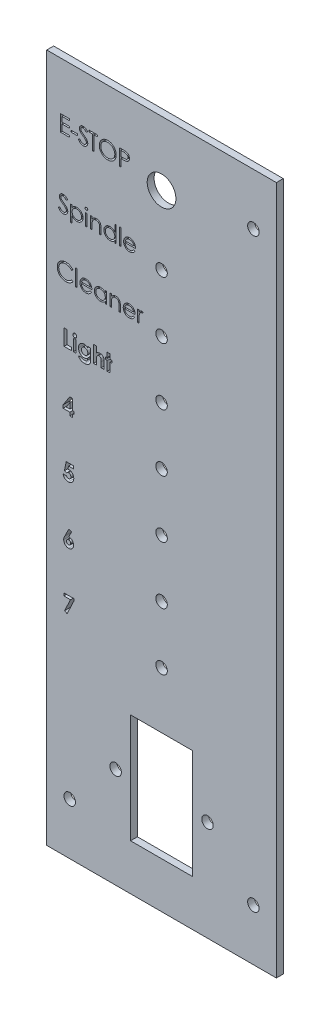
from build123d import *

# Parameters (mm, degrees)
SKETCH1_W           = 100
SKETCH1_H           = 300
BOSS_EXTRUDE1_DEPTH = 3
CUT_EXTRUDE1_REACH  = 160.142
SKETCH2_R           = 2.5
SKETCH2_W           = 27
SKETCH2_H           = 47.5
SKETCH3_R           = 6.25
SKETCH3_R_2         = 2.5
CUT_EXTRUDE2_DEPTH  = 159.142340946
SKETCH4_W           = 2.692307692
SKETCH4_H           = 0.717948718
SKETCH4_W_2         = 0.628205128
SKETCH4_H_2         = 7.179487179
SKETCH4_W_3         = 0.628205129
SKETCH4_H_3         = 5.115384615
SKETCH4_W_4         = 1.256410256
CUT_EXTRUDE3_DEPTH  = 159.142340946
SKETCH5_R           = 2.5
CUT_EXTRUDE4_DEPTH  = 159.142341075


with BuildPart() as part:
    # Sketch1 → Boss-Extrude1 (new body)
    with BuildSketch(Plane.XY):
        Rectangle(SKETCH1_W, SKETCH1_H)
    extrude(amount=BOSS_EXTRUDE1_DEPTH)

    # Sketch2 → Cut-Extrude1 (cut, up to next)
    with BuildSketch(Plane.XY.offset(3), mode=Mode.PRIVATE) as cut_extrude1_sk1:
        with Locations((20, -106.25)):
            Circle(SKETCH2_R)
    cut_extrude1_tool1 = extrude(cut_extrude1_sk1.sketch, amount=-CUT_EXTRUDE1_REACH, mode=Mode.PRIVATE) & part.part
    # Sketch2 → Cut-Extrude1 (cut, up to next)
    with BuildSketch(Plane.XY.offset(3), mode=Mode.PRIVATE) as cut_extrude1_sk2:
        with Locations((-20, -106.25)):
            Circle(SKETCH2_R)
    cut_extrude1_tool2 = extrude(cut_extrude1_sk2.sketch, amount=-CUT_EXTRUDE1_REACH, mode=Mode.PRIVATE) & part.part
    # Sketch2 → Cut-Extrude1 (cut, up to next)
    with BuildSketch(Plane.XY.offset(3), mode=Mode.PRIVATE) as cut_extrude1_sk3:
        with Locations((0, -106.25)):
            Rectangle(SKETCH2_W, SKETCH2_H)
    cut_extrude1_tool3 = extrude(cut_extrude1_sk3.sketch, amount=-CUT_EXTRUDE1_REACH, mode=Mode.PRIVATE) & part.part
    add(cut_extrude1_tool1.solids().sort_by_distance((20, -106.25, 3))[0], mode=Mode.SUBTRACT)
    add(cut_extrude1_tool2.solids().sort_by_distance((-20, -106.25, 3))[0], mode=Mode.SUBTRACT)
    add(cut_extrude1_tool3.solids().sort_by_distance((0, -106.25, 3))[0], mode=Mode.SUBTRACT)

    # Sketch3 → Cut-Extrude2 (cut, through all)
    with BuildSketch(Plane.XY.offset(3)):
        with Locations((0, 122)):
            Circle(SKETCH3_R)
        with Locations((0, 92)):
            Circle(SKETCH3_R_2)
        with Locations((0, 67)):
            Circle(SKETCH3_R_2)
        with Locations((0, 42)):
            Circle(SKETCH3_R_2)
        with Locations((0, 17)):
            Circle(SKETCH3_R_2)
        with Locations((0, -8)):
            Circle(SKETCH3_R_2)
        with Locations((0, -33)):
            Circle(SKETCH3_R_2)
        with Locations((0, -58)):
            Circle(SKETCH3_R_2)
    extrude(amount=-CUT_EXTRUDE2_DEPTH, mode=Mode.SUBTRACT)

    # Sketch4 → Cut-Extrude3 (cut, through all)
    # profile 1 of 31: a face of its own
    with BuildSketch(Plane.XY.offset(3)):
        with BuildLine():
            Line((-18.307692308, 129), (-16.934895833, 129))
            add(Edge.make_bspline(
                [(-16.934895833, 129), (-16.840474021, 128.999896208), (-16.659557635, 128.999697337), (-16.400127524, 128.993667845), (-16.164508061, 128.985614461), (-15.953207299, 128.974450674), (-15.765575103, 128.961257494), (-15.602460504, 128.942753415), (-15.462581391, 128.923432824), (-15.378768492, 128.903790011), (-15.340544872, 128.894831731)],
                knots=[0, 0, 0, 0, 1.415646017, 2.712440637, 3.8905458, 4.950247383, 5.884950622, 6.709939814, 7.411656543, 8, 8, 8, 8], degree=3))
            add(Edge.make_bspline(
                [(-15.340544872, 128.894831731), (-15.292157804, 128.881587831), (-15.19652385, 128.855412108), (-15.058721764, 128.802984661), (-14.927614073, 128.74082033), (-14.802750956, 128.669972451), (-14.68566679, 128.587401322), (-14.574614708, 128.496454087), (-14.470574747, 128.39503095), (-14.374131963, 128.28426947), (-14.285562368, 128.16602905), (-14.209303003, 128.03854459), (-14.145448549, 127.903961984), (-14.090682006, 127.762374841), (-14.051265097, 127.612594194), (-14.021571297, 127.45566077), (-14.002724042, 127.291591389), (-14.000918919, 127.179471654), (-14, 127.122395833)],
                knots=[0, 0, 0, 0, 0.999701418, 1.975846123, 2.934577507, 3.890451536, 4.834027766, 5.787354733, 6.749476667, 7.726910423, 8.712836071, 9.690891519, 10.682875813, 11.679750201, 12.712814741, 13.765529915, 14.8625177, 16, 16, 16, 16], degree=3))
            add(Edge.make_bspline(
                [(-14, 127.122395833), (-14.000842849, 127.06484028), (-14.002491941, 126.952228952), (-14.022284512, 126.787483375), (-14.048944895, 126.630046595), (-14.089939, 126.480267694), (-14.143630346, 126.339036153), (-14.206614452, 126.204193689), (-14.282581513, 126.078034346), (-14.369871172, 125.96010011), (-14.466974361, 125.850280286), (-14.573480237, 125.749370697), (-14.688958822, 125.65796202), (-14.813043118, 125.575849333), (-14.946942816, 125.504936774), (-15.088627123, 125.441422164), (-15.239327556, 125.388080042), (-15.343612584, 125.36001992), (-15.396634615, 125.345753205)],
                knots=[0, 0, 0, 0, 1.121902311, 2.195077645, 3.232258892, 4.234102512, 5.217864754, 6.176164875, 7.132989551, 8.084763148, 9.034132444, 9.988522005, 10.94243251, 11.903244335, 12.886203696, 13.894208494, 14.929344452, 16, 16, 16, 16], degree=3))
            add(Edge.make_bspline(
                [(-15.396634615, 125.345753205), (-15.440489283, 125.336427243), (-15.536599338, 125.315988855), (-15.694884782, 125.293171941), (-15.879175554, 125.27369674), (-16.089220114, 125.259094464), (-16.324829924, 125.246593728), (-16.586132439, 125.23665754), (-16.873640593, 125.231197832), (-17.074183081, 125.230916246), (-17.178886218, 125.230769231)],
                knots=[0, 0, 0, 0, 0.601384939, 1.31797006, 2.144135048, 3.087295005, 4.142315834, 5.309527816, 6.595305764, 8, 8, 8, 8], degree=3))
            Line((-17.178886218, 125.230769231), (-17.679487179, 125.230769231))
            Line((-17.679487179, 125.230769231), (-17.679487179, 122))
            Line((-17.679487179, 122), (-18.307692308, 122))
            Line((-18.307692308, 122), (-18.307692308, 129))
        make_face()
        with BuildLine():
            Line((-17.679487179, 128.282051282), (-17.679487179, 125.948717949))
            Line((-17.679487179, 125.948717949), (-16.453926282, 125.933293269))
            add(Edge.make_bspline(
                [(-16.453926282, 125.933293269), (-16.39408643, 125.933262342), (-16.278566831, 125.933202638), (-16.111694384, 125.941173085), (-15.956875809, 125.95037415), (-15.814586659, 125.963845997), (-15.68476279, 125.982888512), (-15.567187732, 126.002111988), (-15.462773166, 126.029922713), (-15.340574763, 126.067368851), (-15.204408068, 126.131234083), (-15.056272971, 126.223933863), (-14.930731798, 126.342095279), (-14.822095204, 126.474950942), (-14.735883449, 126.622749201), (-14.672771464, 126.780887074), (-14.635689149, 126.947742773), (-14.630716762, 127.061919051), (-14.628205128, 127.119591346)],
                knots=[0, 0, 0, 0, 1.160613943, 2.240541288, 3.23993089, 4.169200891, 5.011653406, 5.7853311, 6.478053781, 7.106038997, 8.262395093, 9.384106736, 10.481365981, 11.59014053, 12.70357646, 13.786202915, 14.881775077, 16, 16, 16, 16], degree=3))
            add(Edge.make_bspline(
                [(-14.628205128, 127.119591346), (-14.630730421, 127.175868373), (-14.635750391, 127.287740137), (-14.673062117, 127.451697659), (-14.735760745, 127.608169067), (-14.822673934, 127.754115238), (-14.928156194, 127.886492846), (-15.05075488, 128.0014871), (-15.190181403, 128.093930506), (-15.319877865, 128.153597069), (-15.435080237, 128.19002762), (-15.535144157, 128.215517301), (-15.648125506, 128.235868513), (-15.774061065, 128.252347519), (-15.911974733, 128.266454441), (-16.063051362, 128.276026396), (-16.226718649, 128.281629308), (-16.340339791, 128.281907219), (-16.399238782, 128.282051282)],
                knots=[0, 0, 0, 0, 1.120700087, 2.227813068, 3.331159281, 4.466773991, 5.599788987, 6.693661531, 7.80175334, 8.91857717, 9.525282508, 10.207424825, 10.974604443, 11.810962634, 12.737642355, 13.736264703, 14.826523623, 16, 16, 16, 16], degree=3))
            Line((-16.399238782, 128.282051282), (-17.679487179, 128.282051282))
        make_face(mode=Mode.SUBTRACT)
    # profile 2 of 31: a face of its own
    with BuildSketch(Plane.XY.offset(3)):
        with BuildLine():
            add(Edge.make_bspline(
                [(-23.467948718, 129.179487179), (-23.338332506, 129.176204221), (-23.083755572, 129.169756219), (-22.709605777, 129.120398012), (-22.352415586, 129.035007232), (-22.009275309, 128.921281267), (-21.684289355, 128.769572496), (-21.37501157, 128.586202199), (-21.082177823, 128.369249282), (-20.80973506, 128.120390828), (-20.560421159, 127.84962392), (-20.340769387, 127.5606681), (-20.156684799, 127.255270496), (-20.005513225, 126.934348834), (-19.886916005, 126.598628898), (-19.805077918, 126.246320893), (-19.752801618, 125.879707513), (-19.746690063, 125.629653783), (-19.743589744, 125.502804487)],
                knots=[0, 0, 0, 0, 1.065120563, 2.091984664, 3.0946048, 4.079830382, 5.057816894, 6.036188127, 7.030412546, 8.04752943, 9.064399622, 10.05169764, 11.02544977, 11.989514704, 12.962713494, 13.945757189, 14.957906945, 16, 16, 16, 16], degree=3))
            add(Edge.make_bspline(
                [(-19.743589744, 125.502804487), (-19.746689609, 125.376889594), (-19.752799802, 125.128696754), (-19.805137357, 124.764409865), (-19.887219357, 124.414228472), (-20.004411889, 124.078737167), (-20.154862846, 123.757582039), (-20.340173188, 123.451608131), (-20.55845561, 123.160715135), (-20.806869312, 122.888089804), (-21.077671396, 122.638094863), (-21.36813193, 122.420257111), (-21.671718569, 122.232808862), (-21.992337986, 122.083241514), (-22.325738059, 121.963697673), (-22.674902706, 121.882192413), (-23.038195814, 121.829618327), (-23.285937821, 121.823581295), (-23.411858974, 121.820512821)],
                knots=[0, 0, 0, 0, 1.043624062, 2.057103931, 3.04512605, 4.022047818, 4.998200453, 5.980619268, 6.982898556, 8.009068085, 9.034988726, 10.034168286, 11.015286542, 11.987931943, 12.962482838, 13.94673481, 14.956375938, 16, 16, 16, 16], degree=3))
            add(Edge.make_bspline(
                [(-23.411858974, 121.820512821), (-23.538707612, 121.823611594), (-23.788760044, 121.829720102), (-24.155834115, 121.882082912), (-24.508389603, 121.963965519), (-24.845418305, 122.080984392), (-25.167108164, 122.232218853), (-25.47408833, 122.416627611), (-25.765126624, 122.635441894), (-26.037810117, 122.883775043), (-26.287308513, 123.154118147), (-26.504827265, 123.443786657), (-26.689277492, 123.74709757), (-26.840004156, 124.064892619), (-26.959333075, 124.395635504), (-27.040742711, 124.741532459), (-27.093414616, 125.100611471), (-27.099484309, 125.345097267), (-27.102564103, 125.469150641)],
                knots=[0, 0, 0, 0, 1.053102029, 2.075944431, 3.073151272, 4.055350789, 5.033113405, 6.020478099, 7.024410459, 8.052272461, 9.079885166, 10.07527673, 11.055994387, 12.023226415, 12.992069828, 13.970394897, 14.97016774, 16, 16, 16, 16], degree=3))
            add(Edge.make_bspline(
                [(-27.102564103, 125.469150641), (-27.101494832, 125.552415979), (-27.099369779, 125.717896226), (-27.073786394, 125.963629427), (-27.036662992, 126.205410742), (-26.983459166, 126.442552638), (-26.913875832, 126.674474607), (-26.831771778, 126.902776133), (-26.731492087, 127.125143581), (-26.618130791, 127.342630364), (-26.491607175, 127.551846176), (-26.351855676, 127.749605342), (-26.203784939, 127.937567336), (-26.041458152, 128.110861343), (-25.870225261, 128.274528656), (-25.687308505, 128.42605409), (-25.493824016, 128.566803992), (-25.288939257, 128.693644674), (-25.077702707, 128.808362943), (-24.859949151, 128.906806645), (-24.638636008, 128.991298768), (-24.412726713, 129.059780419), (-24.182821168, 129.113844491), (-23.948417599, 129.150659198), (-23.709702747, 129.176307834), (-23.548880109, 129.178422838), (-23.467948718, 129.179487179)],
                knots=[0, 0, 0, 0, 1.037015668, 2.060948919, 3.074880161, 4.083647147, 5.086022904, 6.090072063, 7.104153813, 8.122640571, 9.144368836, 10.147691507, 11.138137339, 12.123020368, 13.103399296, 14.087645067, 15.080126199, 16.082011238, 17.087798457, 18.072939717, 19.057185487, 20.037253025, 21.01195951, 21.997135196, 22.992090687, 24, 24, 24, 24], degree=3))
        make_face()
        with BuildLine():
            add(Edge.make_bspline(
                [(-23.437099359, 128.461538462), (-23.503528626, 128.460728681), (-23.635752092, 128.459116862), (-23.832321164, 128.43788543), (-24.026305032, 128.407625652), (-24.217743756, 128.364462611), (-24.405836335, 128.305654505), (-24.592336018, 128.237972689), (-24.775542125, 128.155530508), (-24.954849841, 128.062385099), (-25.128679991, 127.959287257), (-25.292705394, 127.845343723), (-25.447350682, 127.723226615), (-25.592237215, 127.59265094), (-25.72693956, 127.452951737), (-25.854108963, 127.306246864), (-25.968648126, 127.148343082), (-26.07361928, 126.983522269), (-26.16755496, 126.811999106), (-26.25108567, 126.635579382), (-26.319413687, 126.452824008), (-26.37513844, 126.265715693), (-26.421338061, 126.074550774), (-26.45060591, 125.877879076), (-26.472070629, 125.676688852), (-26.473590319, 125.540725144), (-26.474358974, 125.471955128)],
                knots=[0, 0, 0, 0, 1.008559885, 2.007477868, 2.99961109, 3.989939068, 4.984837346, 5.991145699, 7.001802488, 8.033829008, 9.059044045, 10.069351652, 11.065060232, 12.050310815, 13.029377138, 14.011219647, 14.996725999, 15.989392538, 16.977580475, 17.965360261, 18.951710183, 19.937753436, 20.929683414, 21.935841486, 22.955955122, 24, 24, 24, 24], degree=3))
            add(Edge.make_bspline(
                [(-26.474358974, 125.471955128), (-26.47180925, 125.370830687), (-26.466793155, 125.171887626), (-26.422878014, 124.880351338), (-26.355234066, 124.600174766), (-26.255519333, 124.332890947), (-26.130818103, 124.076202381), (-25.976764323, 123.832386172), (-25.794246152, 123.601376423), (-25.586919099, 123.384785885), (-25.360273685, 123.187094277), (-25.119608225, 123.01356746), (-24.86750101, 122.86674696), (-24.603294605, 122.747136815), (-24.328399527, 122.65235734), (-24.041044425, 122.587400077), (-23.743143506, 122.544649167), (-23.540082195, 122.540543655), (-23.437099359, 122.538461538)],
                knots=[0, 0, 0, 0, 1.032063989, 2.030389145, 3.003944642, 3.970395727, 4.937377036, 5.913328081, 6.909231446, 7.93887556, 8.970685674, 9.976071282, 10.964166581, 11.944589148, 12.933237628, 13.927779006, 14.949070134, 16, 16, 16, 16], degree=3))
            add(Edge.make_bspline(
                [(-23.437099359, 122.538461538), (-23.367880356, 122.539412547), (-23.230598283, 122.541298683), (-23.026407238, 122.560296037), (-22.825894815, 122.590759776), (-22.629342255, 122.634621087), (-22.436972632, 122.6895155), (-22.247983026, 122.754730956), (-22.064386445, 122.836093363), (-21.88386677, 122.925989266), (-21.711074286, 123.028469581), (-21.546123222, 123.138545881), (-21.393171262, 123.260483122), (-21.248393119, 123.389118747), (-21.113137741, 123.527046443), (-20.988319773, 123.674086886), (-20.874359509, 123.831168201), (-20.769428215, 123.995739012), (-20.67582169, 124.167731518), (-20.594263492, 124.344790874), (-20.52507126, 124.526481092), (-20.46921425, 124.713064235), (-20.425443327, 124.904185933), (-20.395283487, 125.100102089), (-20.37418661, 125.300420774), (-20.372596456, 125.435908486), (-20.371794872, 125.504206731)],
                knots=[0, 0, 0, 0, 1.047197238, 2.076906641, 3.100256066, 4.114471768, 5.12198147, 6.126382909, 7.136867548, 8.15857795, 9.17633901, 10.174870724, 11.156907918, 12.133735059, 13.104061851, 14.077631395, 15.04955518, 16.038496417, 17.029181396, 18.010275684, 18.986308667, 19.968651475, 20.955262928, 21.950658345, 22.966943676, 24, 24, 24, 24], degree=3))
            add(Edge.make_bspline(
                [(-20.371794872, 125.504206731), (-20.372597098, 125.572037739), (-20.374188461, 125.70659304), (-20.39527341, 125.905514676), (-20.425475191, 126.100021099), (-20.469000607, 126.289348705), (-20.525100914, 126.473545755), (-20.594275575, 126.652439251), (-20.675846174, 126.826695641), (-20.769462623, 126.995884235), (-20.87469427, 127.158233711), (-20.989682756, 127.313438536), (-21.116413453, 127.458584019), (-21.251265502, 127.597253407), (-21.397607273, 127.726489186), (-21.554775861, 127.846334227), (-21.720863217, 127.959680776), (-21.896717688, 128.0619319), (-22.078205595, 128.156360365), (-22.264433511, 128.237262371), (-22.45329171, 128.30600661), (-22.644299935, 128.36464054), (-22.839065892, 128.4074566), (-23.036273549, 128.4379127), (-23.235650066, 128.459109472), (-23.369736506, 128.460726229), (-23.437099359, 128.461538462)],
                knots=[0, 0, 0, 0, 1.02996197, 2.043119294, 3.035359645, 4.018872909, 4.991431989, 5.957985074, 6.929999688, 7.912076566, 8.892894881, 9.867085534, 10.843653904, 11.817741046, 12.803660682, 13.806313499, 14.818574707, 15.856120519, 16.894564902, 17.924820532, 18.937903209, 19.946497019, 20.957711757, 21.963978472, 22.977135795, 24, 24, 24, 24], degree=3))
        make_face(mode=Mode.SUBTRACT)
    # profile 3 of 31: a face of its own
    with BuildSketch(Plane.XY.offset(3)):
        Polygon((-31.5, 128.282051282), (-31.5, 129), (-27.820512821, 129), (-27.820512821, 128.282051282), (-29.346153846, 128.282051282), (-29.346153846, 122), (-29.974358974, 122), (-29.974358974, 128.282051282), align=None)
    # profile 4 of 31: a face of its own
    with BuildSketch(Plane.XY.offset(3)):
        with BuildLine():
            Line((-36.256410256, 123.350360577), (-35.664663462, 123.705128205))
            add(Edge.make_bspline(
                [(-35.664663462, 123.705128205), (-35.609626987, 123.612999435), (-35.504179226, 123.436484267), (-35.328276507, 123.197968187), (-35.146010685, 122.995243873), (-34.956032018, 122.829490658), (-34.759500122, 122.698992884), (-34.555132014, 122.606588421), (-34.343616393, 122.54895647), (-34.19966875, 122.541956297), (-34.127804487, 122.538461538)],
                knots=[0, 0, 0, 0, 1.272034388, 2.437168799, 3.508375237, 4.49857839, 5.41946034, 6.295179144, 7.148887113, 8, 8, 8, 8], degree=3))
            add(Edge.make_bspline(
                [(-34.127804487, 122.538461538), (-34.066430766, 122.540170883), (-33.94475722, 122.543559664), (-33.765632734, 122.576121268), (-33.59166913, 122.626145526), (-33.426451854, 122.697787389), (-33.272260625, 122.78446436), (-33.137047234, 122.889156715), (-33.020155008, 123.006369127), (-32.924536779, 123.137134436), (-32.851176708, 123.277768733), (-32.794792572, 123.422120636), (-32.763502424, 123.572457773), (-32.758788917, 123.673678698), (-32.756410256, 123.724759615)],
                knots=[0, 0, 0, 0, 1.095163259, 2.171163733, 3.241058638, 4.321873601, 5.38011039, 6.391990106, 7.366004449, 8.327778327, 9.272591725, 10.192022065, 11.087607919, 12, 12, 12, 12], degree=3))
            add(Edge.make_bspline(
                [(-32.756410256, 123.724759615), (-32.759358878, 123.783041315), (-32.765352994, 123.901519493), (-32.816015954, 124.076318799), (-32.895714448, 124.249303939), (-32.969239735, 124.35630647), (-33.007411859, 124.411858974)],
                knots=[0, 0, 0, 0, 0.938893495, 1.908633276, 2.914225137, 4, 4, 4, 4], degree=3))
            add(Edge.make_bspline(
                [(-33.007411859, 124.411858974), (-33.038753087, 124.451952622), (-33.104550076, 124.536124219), (-33.217665101, 124.66141469), (-33.35039733, 124.790651528), (-33.49820444, 124.928769641), (-33.666470617, 125.069345235), (-33.849925646, 125.219081791), (-34.053253364, 125.372284945), (-34.195852357, 125.475030076), (-34.26943109, 125.528044872)],
                knots=[0, 0, 0, 0, 0.722233717, 1.516239348, 2.393582979, 3.351407094, 4.387010283, 5.505090956, 6.712668013, 8, 8, 8, 8], degree=3))
            add(Edge.make_bspline(
                [(-34.26943109, 125.528044872), (-34.343079082, 125.580502047), (-34.483888435, 125.680796172), (-34.6808056, 125.82964474), (-34.856894526, 125.965732479), (-35.011372559, 126.090340503), (-35.144171753, 126.203485712), (-35.256338575, 126.304081591), (-35.345015689, 126.394848712), (-35.39432685, 126.453731396), (-35.416466346, 126.480168269)],
                knots=[0, 0, 0, 0, 1.452282411, 2.77665338, 3.964542531, 5.026858415, 5.96415736, 6.766646006, 7.446254459, 8, 8, 8, 8], degree=3))
            add(Edge.make_bspline(
                [(-35.416466346, 126.480168269), (-35.447411437, 126.521370343), (-35.50826911, 126.60239975), (-35.588601121, 126.729049466), (-35.656879447, 126.858695997), (-35.710404111, 126.991687726), (-35.755476549, 127.126157584), (-35.78579241, 127.263860075), (-35.804775204, 127.404177312), (-35.806719177, 127.498604313), (-35.807692308, 127.545873397)],
                knots=[0, 0, 0, 0, 1.068054152, 2.10047183, 3.106115577, 4.101338837, 5.06977816, 6.043150881, 7.020423561, 8, 8, 8, 8], degree=3))
            add(Edge.make_bspline(
                [(-35.807692308, 127.545873397), (-35.80508189, 127.619932947), (-35.79991685, 127.766469074), (-35.756235815, 127.980530735), (-35.687290028, 128.184903569), (-35.590700252, 128.377564237), (-35.466185546, 128.553496199), (-35.322093597, 128.714723173), (-35.150470625, 128.850260337), (-34.962165378, 128.968684454), (-34.756052634, 129.061376304), (-34.540070827, 129.131298264), (-34.313876683, 129.17091678), (-34.160670414, 129.17660231), (-34.082932692, 129.179487179)],
                knots=[0, 0, 0, 0, 1.005424448, 1.989358655, 2.955360095, 3.929531133, 4.905563448, 5.876582895, 6.856512386, 7.866279853, 8.892233794, 9.918561126, 10.94386622, 12, 12, 12, 12], degree=3))
            add(Edge.make_bspline(
                [(-34.082932692, 129.179487179), (-34.000444492, 129.176642076), (-33.836401788, 129.170984074), (-33.595103357, 129.121789011), (-33.362781924, 129.040387668), (-33.175895395, 128.948010352), (-33.029629872, 128.85574752), (-32.918084406, 128.771707872), (-32.805049505, 128.674957655), (-32.689613395, 128.565239163), (-32.573732076, 128.44154566), (-32.455685172, 128.304724283), (-32.335196634, 128.155611171), (-32.257684914, 128.049162169), (-32.217948718, 127.994591346)],
                knots=[0, 0, 0, 0, 1.286793592, 2.559021753, 3.825965368, 5.121522368, 5.803751409, 6.523245864, 7.299691795, 8.125521123, 9.008227632, 9.944561021, 10.946284179, 12, 12, 12, 12], degree=3))
            Line((-32.217948718, 127.994591346), (-32.785857372, 127.564102564))
            add(Edge.make_bspline(
                [(-32.785857372, 127.564102564), (-32.820149237, 127.608279945), (-32.886187351, 127.693355251), (-32.986446325, 127.812497883), (-33.08094362, 127.921330842), (-33.17404442, 128.015861098), (-33.260831683, 128.101265364), (-33.345065767, 128.174384878), (-33.42553447, 128.235936069), (-33.526968291, 128.301623189), (-33.654403728, 128.366736196), (-33.8143728, 128.421834352), (-33.98154535, 128.454944476), (-34.095404613, 128.459322251), (-34.153044872, 128.461538462)],
                knots=[0, 0, 0, 0, 1.181633172, 2.275549214, 3.290209073, 4.226197932, 5.078386478, 5.862611352, 6.581680152, 7.217281963, 8.414376989, 9.595101626, 10.782541182, 12, 12, 12, 12], degree=3))
            add(Edge.make_bspline(
                [(-34.153044872, 128.461538462), (-34.225357917, 128.459115062), (-34.364806811, 128.454441763), (-34.562787284, 128.403401793), (-34.740975134, 128.323038072), (-34.894080264, 128.210408116), (-35.021554218, 128.07696613), (-35.113765136, 127.92340842), (-35.169265465, 127.753843615), (-35.176038024, 127.635560302), (-35.179487179, 127.575320513)],
                knots=[0, 0, 0, 0, 1.14458467, 2.207223713, 3.21896685, 4.227309161, 5.202851033, 6.127160689, 7.046193047, 8, 8, 8, 8], degree=3))
            add(Edge.make_bspline(
                [(-35.179487179, 127.575320513), (-35.178700926, 127.537817556), (-35.177127134, 127.462750317), (-35.155177539, 127.351847473), (-35.126978881, 127.241224794), (-35.082293617, 127.131379628), (-35.02060301, 127.02039091), (-34.939592658, 126.906347435), (-34.837566034, 126.788244018), (-34.759412009, 126.71142927), (-34.718149038, 126.670873397)],
                knots=[0, 0, 0, 0, 0.858281714, 1.717966888, 2.583508476, 3.4729293, 4.427298488, 5.488583878, 6.674047936, 8, 8, 8, 8], degree=3))
            add(Edge.make_bspline(
                [(-34.718149038, 126.670873397), (-34.702826294, 126.657199346), (-34.666422959, 126.624712929), (-34.599871108, 126.571528368), (-34.511985511, 126.505922823), (-34.405061109, 126.42474819), (-34.277126386, 126.330585266), (-34.128167273, 126.224638042), (-33.959844208, 126.103467124), (-33.840400376, 126.018752043), (-33.77724359, 125.973958333)],
                knots=[0, 0, 0, 0, 0.420754252, 0.999615792, 1.744751191, 2.668019286, 3.750313428, 4.999500688, 6.413464383, 8, 8, 8, 8], degree=3))
            add(Edge.make_bspline(
                [(-33.77724359, 125.973958333), (-33.701271763, 125.918675614), (-33.55416285, 125.811628291), (-33.344847691, 125.650796931), (-33.155060074, 125.493501394), (-32.984133667, 125.340746179), (-32.83037985, 125.193689993), (-32.695504409, 125.050563633), (-32.578133048, 124.912392487), (-32.451774611, 124.735247336), (-32.322658972, 124.517685167), (-32.211775957, 124.25112869), (-32.141859263, 123.983536049), (-32.132716232, 123.803682376), (-32.128205128, 123.71494391)],
                knots=[0, 0, 0, 0, 1.163667725, 2.253281268, 3.268753668, 4.215851969, 5.092017293, 5.902905408, 6.650798638, 7.335211899, 8.59617414, 9.77448103, 10.901945474, 12, 12, 12, 12], degree=3))
            add(Edge.make_bspline(
                [(-32.128205128, 123.71494391), (-32.129519404, 123.65218718), (-32.132122435, 123.527892413), (-32.162044262, 123.345382259), (-32.205883592, 123.16812052), (-32.27195806, 122.998298295), (-32.352604377, 122.83280877), (-32.454936873, 122.675992969), (-32.573552242, 122.524380172), (-32.709619772, 122.382013189), (-32.858511577, 122.251320797), (-33.015878966, 122.135062674), (-33.181979512, 122.038126027), (-33.355912145, 121.959024343), (-33.537716819, 121.897157308), (-33.727332386, 121.85233157), (-33.925071409, 121.824820148), (-34.059472372, 121.821964625), (-34.127804487, 121.820512821)],
                knots=[0, 0, 0, 0, 0.983748083, 1.948392443, 2.894712957, 3.844097841, 4.80183111, 5.778335162, 6.776009319, 7.81870978, 8.863265674, 9.881300176, 10.883814829, 11.87499822, 12.874611388, 13.892143829, 14.928324115, 16, 16, 16, 16], degree=3))
            add(Edge.make_bspline(
                [(-34.127804487, 121.820512821), (-34.180675173, 121.821535184), (-34.285750693, 121.823567034), (-34.441169657, 121.841529595), (-34.593448835, 121.866943803), (-34.740677399, 121.907291942), (-34.884752223, 121.956245897), (-35.025046692, 122.016522562), (-35.1616288, 122.088756965), (-35.295263965, 122.171347014), (-35.425612314, 122.267462503), (-35.55145125, 122.379409496), (-35.676909621, 122.504100506), (-35.798284414, 122.644921633), (-35.918030703, 122.799597798), (-36.033787522, 122.969576165), (-36.147950957, 123.153930873), (-36.219581893, 123.283661044), (-36.256410256, 123.350360577)],
                knots=[0, 0, 0, 0, 0.915332311, 1.819136955, 2.706846663, 3.586547465, 4.459518054, 5.340707479, 6.227863349, 7.133153174, 8.059268498, 9.028702269, 10.047606654, 11.120612155, 12.245963614, 13.433783089, 14.680604001, 16, 16, 16, 16], degree=3))
        make_face()
    # profile 5 of 31: a face of its own
    with BuildSketch(Plane.XY.offset(3)):
        with Locations((-38.051282051, 124.692307692)):
            Rectangle(SKETCH4_W, SKETCH4_H)
    # profile 6 of 31: a face of its own
    with BuildSketch(Plane.XY.offset(3)):
        Polygon((-43.974358974, 129), (-40.025641026, 129), (-40.025641026, 128.282051282), (-43.346153846, 128.282051282), (-43.346153846, 126.128205128), (-40.025641026, 126.128205128), (-40.025641026, 125.41025641), (-43.346153846, 125.41025641), (-43.346153846, 122.717948718), (-40.025641026, 122.717948718), (-40.025641026, 122), (-43.974358974, 122), align=None)
    # profile 7 of 31: a face of its own
    with BuildSketch(Plane.XY.offset(3)):
        with BuildLine():
            Line((-12.135016026, 93.615384615), (-11.576923077, 93.322315705))
            add(Edge.make_bspline(
                [(-11.576923077, 93.322315705), (-11.621396267, 93.243429043), (-11.707923484, 93.089946837), (-11.85672498, 92.879083116), (-12.012709125, 92.689387684), (-12.182917061, 92.525928376), (-12.362256419, 92.383425606), (-12.551721729, 92.258749956), (-12.752299364, 92.152512916), (-12.963998814, 92.06300786), (-13.188597916, 91.994188872), (-13.426640949, 91.94558043), (-13.67858394, 91.915533893), (-13.851276299, 91.912043611), (-13.939703526, 91.91025641)],
                knots=[0, 0, 0, 0, 1.120438281, 2.179929193, 3.190490725, 4.156257408, 5.095198341, 6.022838206, 6.959905092, 7.901321166, 8.864066838, 9.862729781, 10.905609505, 12, 12, 12, 12], degree=3))
            add(Edge.make_bspline(
                [(-13.939703526, 91.91025641), (-14.037987481, 91.912550761), (-14.229711004, 91.917026374), (-14.508790498, 91.955611303), (-14.771549335, 92.018556021), (-15.017972742, 92.106487104), (-15.247457247, 92.221341752), (-15.460458957, 92.361260715), (-15.658098008, 92.525525225), (-15.834146427, 92.715558112), (-15.992634192, 92.918922026), (-16.132485832, 93.130833795), (-16.249400694, 93.350760244), (-16.344505915, 93.577301292), (-16.421315644, 93.809029079), (-16.474849052, 94.048052015), (-16.505708548, 94.293723183), (-16.510437439, 94.459917854), (-16.512820513, 94.543669872)],
                knots=[0, 0, 0, 0, 1.145258523, 2.234067595, 3.276747158, 4.290159414, 5.277019952, 6.260822364, 7.254936242, 8.264827045, 9.274100331, 10.257902744, 11.220704747, 12.172965371, 13.118907548, 14.062713208, 15.023725156, 16, 16, 16, 16], degree=3))
            add(Edge.make_bspline(
                [(-16.512820513, 94.543669872), (-16.51070223, 94.622259533), (-16.506504074, 94.778013862), (-16.480042499, 95.008544951), (-16.433145913, 95.232601856), (-16.368793265, 95.450370752), (-16.285690772, 95.66148702), (-16.184026334, 95.866079147), (-16.063641578, 96.063929427), (-15.970696231, 96.188735694), (-15.923878205, 96.251602564)],
                knots=[0, 0, 0, 0, 1.024358464, 2.0301432, 3.019427413, 4.004406732, 4.986367066, 5.972626655, 6.978780325, 8, 8, 8, 8], degree=3))
            add(Edge.make_bspline(
                [(-15.923878205, 96.251602564), (-15.86046284, 96.327340304), (-15.735640946, 96.476416605), (-15.524528236, 96.672293257), (-15.295927843, 96.836380807), (-15.052704591, 96.972395079), (-14.792031643, 97.075742373), (-14.517413061, 97.152757538), (-14.225721888, 97.19591356), (-14.026311446, 97.202009227), (-13.924278846, 97.205128205)],
                knots=[0, 0, 0, 0, 1.030682036, 2.02871468, 2.997146059, 3.962720338, 4.930598197, 5.918074684, 6.934738563, 8, 8, 8, 8], degree=3))
            add(Edge.make_bspline(
                [(-13.924278846, 97.205128205), (-13.819383636, 97.202420107), (-13.613603144, 97.197107437), (-13.313538902, 97.14785477), (-13.029617469, 97.069749661), (-12.76195246, 96.95944208), (-12.510516738, 96.817122976), (-12.276944639, 96.640839293), (-12.057241614, 96.436003119), (-11.929424456, 96.2784767), (-11.864383013, 96.198317308)],
                knots=[0, 0, 0, 0, 1.056321875, 2.072262726, 3.055038591, 4.01806755, 4.982017516, 5.957941055, 6.960871419, 8, 8, 8, 8], degree=3))
            add(Edge.make_bspline(
                [(-11.864383013, 96.198317308), (-11.820129136, 96.137910145), (-11.73191595, 96.017497908), (-11.62142175, 95.821155593), (-11.52550696, 95.615734405), (-11.448841038, 95.39791381), (-11.386762036, 95.17027465), (-11.341848398, 94.931189561), (-11.315509161, 94.680729738), (-11.310331766, 94.510076627), (-11.307692308, 94.423076923)],
                knots=[0, 0, 0, 0, 0.94817472, 1.890038105, 2.849395472, 3.817997239, 4.812318967, 5.836947057, 6.897266129, 8, 8, 8, 8], degree=3))
            Line((-11.307692308, 94.423076923), (-15.884615385, 94.423076923))
            add(Edge.make_bspline(
                [(-15.884615385, 94.423076923), (-15.881536172, 94.355675995), (-15.875481024, 94.223134787), (-15.847250738, 94.029193221), (-15.80275319, 93.844446537), (-15.740215065, 93.670280453), (-15.664481374, 93.504420198), (-15.571709941, 93.348096124), (-15.461030833, 93.202020264), (-15.337579434, 93.064885988), (-15.200165243, 92.942764466), (-15.055599749, 92.833460914), (-14.901812619, 92.74184972), (-14.740016452, 92.667489941), (-14.570472882, 92.609277309), (-14.393128491, 92.569541667), (-14.208332259, 92.542927453), (-14.082360791, 92.539968123), (-14.018229167, 92.538461538)],
                knots=[0, 0, 0, 0, 1.094153842, 2.151609401, 3.174256925, 4.172055639, 5.149267565, 6.128595816, 7.11444997, 8.118368179, 9.117203808, 10.09244225, 11.054858984, 12.015122123, 12.976791628, 13.957293641, 14.960065497, 16, 16, 16, 16], degree=3))
            add(Edge.make_bspline(
                [(-14.018229167, 92.538461538), (-13.955526871, 92.539677652), (-13.83111349, 92.542090654), (-13.645831775, 92.565554476), (-13.46355272, 92.603495027), (-13.285030754, 92.655275007), (-13.113889062, 92.718428711), (-12.955397962, 92.794634427), (-12.80963753, 92.87893392), (-12.673403597, 92.97535327), (-12.54126161, 93.093369644), (-12.410176638, 93.240641086), (-12.269623331, 93.414816142), (-12.181644145, 93.545907474), (-12.135016026, 93.615384615)],
                knots=[0, 0, 0, 0, 0.99110716, 1.966546729, 2.947904876, 3.932708344, 4.903319531, 5.828989031, 6.710028674, 7.56322171, 8.463672341, 9.504779593, 10.677557249, 12, 12, 12, 12], degree=3))
        make_face()
        with BuildLine():
            add(Edge.make_bspline(
                [(-11.935897436, 95.051282051), (-11.958890685, 95.134607799), (-12.003145288, 95.29498304), (-12.095618017, 95.517064821), (-12.199761098, 95.714440623), (-12.323004561, 95.885599889), (-12.462642012, 96.037606915), (-12.623932378, 96.170444085), (-12.804804165, 96.289278987), (-13.004322446, 96.389583986), (-13.215606016, 96.474963704), (-13.4368184, 96.532213935), (-13.662533976, 96.57143302), (-13.815202548, 96.575085237), (-13.892027244, 96.576923077)],
                knots=[0, 0, 0, 0, 1.154881502, 2.222775134, 3.210006277, 4.132804581, 5.035138423, 5.962687519, 6.919655026, 7.923214229, 8.944639381, 9.960483929, 10.97369054, 12, 12, 12, 12], degree=3))
            add(Edge.make_bspline(
                [(-13.892027244, 96.576923077), (-13.954726121, 96.575699734), (-14.078668619, 96.573281442), (-14.261270755, 96.550341183), (-14.436630153, 96.512421493), (-14.606040728, 96.46049158), (-14.767282465, 96.391274375), (-14.923672001, 96.310107922), (-15.071232794, 96.211024754), (-15.163515385, 96.135507045), (-15.210136218, 96.097355769)],
                knots=[0, 0, 0, 0, 1.04873581, 2.073130211, 3.073294108, 4.04793562, 5.032784715, 6.005352987, 6.992311501, 8, 8, 8, 8], degree=3))
            add(Edge.make_bspline(
                [(-15.210136218, 96.097355769), (-15.243522782, 96.067167138), (-15.31108905, 96.006072706), (-15.401370093, 95.900814293), (-15.487811039, 95.787311168), (-15.566478344, 95.661220919), (-15.638633517, 95.523979361), (-15.706153471, 95.376744091), (-15.766926296, 95.21839783), (-15.801118516, 95.108052952), (-15.818709936, 95.051282051)],
                knots=[0, 0, 0, 0, 0.879870761, 1.780643979, 2.707998968, 3.669668524, 4.684282772, 5.740141944, 6.837334558, 8, 8, 8, 8], degree=3))
            Line((-15.818709936, 95.051282051), (-11.935897436, 95.051282051))
        make_face(mode=Mode.SUBTRACT)
    # profile 8 of 31: a face of its own
    with BuildSketch(Plane.XY.offset(3)):
        with Locations((-18.083333333, 95.58974359)):
            Rectangle(SKETCH4_W_2, SKETCH4_H_2)
    # profile 9 of 31: a face of its own
    with BuildSketch(Plane.XY.offset(3)):
        with BuildLine():
            Line((-19.743589744, 99.179487179), (-19.743589744, 92))
            Line((-19.743589744, 92), (-20.371794872, 92))
            Line((-20.371794872, 92), (-20.371794872, 92.884815705))
            add(Edge.make_bspline(
                [(-20.371794872, 92.884815705), (-20.442632453, 92.804736517), (-20.580872884, 92.648460975), (-20.81175512, 92.44429663), (-21.056491475, 92.275539987), (-21.313894118, 92.139240156), (-21.583730604, 92.036856043), (-21.865402779, 91.964083725), (-22.159025541, 91.917296054), (-22.35953025, 91.912624011), (-22.461137821, 91.91025641)],
                knots=[0, 0, 0, 0, 1.074387032, 2.096679803, 3.090159297, 4.057316773, 5.018401886, 5.985159533, 6.978961417, 8, 8, 8, 8], degree=3))
            add(Edge.make_bspline(
                [(-22.461137821, 91.91025641), (-22.551473728, 91.912709155), (-22.729620138, 91.917546076), (-22.991678292, 91.955070683), (-23.243862791, 92.015331926), (-23.486411936, 92.099133705), (-23.717756227, 92.210295348), (-23.939876421, 92.343377844), (-24.151621805, 92.501859505), (-24.349764883, 92.683035561), (-24.532228883, 92.879825536), (-24.692351429, 93.089716629), (-24.825857588, 93.311801237), (-24.93749775, 93.543267545), (-25.023490439, 93.785897384), (-25.083437707, 94.03885172), (-25.120918601, 94.301831467), (-25.125753522, 94.480910513), (-25.128205128, 94.571714744)],
                knots=[0, 0, 0, 0, 1.033919861, 2.038935746, 3.024066025, 3.998881131, 4.97069526, 5.957263378, 6.95902576, 7.993208707, 9.027059324, 10.027763471, 11.009749337, 11.988697705, 12.965288445, 13.950418724, 14.960734635, 16, 16, 16, 16], degree=3))
            add(Edge.make_bspline(
                [(-25.128205128, 94.571714744), (-25.125699185, 94.660642151), (-25.120745072, 94.836446837), (-25.083838632, 95.095004233), (-25.021776615, 95.344040755), (-24.934680919, 95.582754641), (-24.82299701, 95.811434742), (-24.687140835, 96.030242792), (-24.527102586, 96.239781587), (-24.342597772, 96.43512404), (-24.142728232, 96.615565269), (-23.92891077, 96.77238336), (-23.706464207, 96.907817057), (-23.471938186, 97.01512401), (-23.228803977, 97.101942219), (-22.974897085, 97.162008155), (-22.711273928, 97.197402798), (-22.532292944, 97.202528326), (-22.44150641, 97.205128205)],
                knots=[0, 0, 0, 0, 1.020392517, 2.01726096, 2.990465484, 3.961182959, 4.928053699, 5.906110375, 6.912531644, 7.948652711, 8.985773172, 9.998621852, 10.987621588, 11.969261332, 12.953316658, 13.946091881, 14.958173133, 16, 16, 16, 16], degree=3))
            add(Edge.make_bspline(
                [(-22.44150641, 97.205128205), (-22.337072795, 97.201994013), (-22.132081213, 97.195841942), (-21.83228417, 97.144429208), (-21.548708949, 97.058103453), (-21.279722974, 96.93992089), (-21.026929854, 96.786319388), (-20.788476573, 96.600816492), (-20.568509927, 96.3781622), (-20.438366282, 96.210939053), (-20.371794872, 96.125400641)],
                knots=[0, 0, 0, 0, 1.031072012, 2.023879775, 2.993683497, 3.952812103, 4.918022106, 5.908088563, 6.929940113, 8, 8, 8, 8], degree=3))
            Line((-20.371794872, 96.125400641), (-20.371794872, 99.179487179))
            Line((-20.371794872, 99.179487179), (-19.743589744, 99.179487179))
        make_face()
        with BuildLine():
            add(Edge.make_bspline(
                [(-22.433092949, 96.576923077), (-22.524921624, 96.573655801), (-22.706176824, 96.567206719), (-22.972264829, 96.516859729), (-23.226891657, 96.43309054), (-23.468783805, 96.318526738), (-23.694120238, 96.174469265), (-23.89550758, 96.000226498), (-24.074592983, 95.80055247), (-24.225209511, 95.576348249), (-24.347990505, 95.335992067), (-24.434324569, 95.084743191), (-24.491263064, 94.827133236), (-24.497080105, 94.652407864), (-24.5, 94.564703526)],
                knots=[0, 0, 0, 0, 1.031046209, 2.035121221, 3.029706178, 4.034933723, 5.034054252, 6.02443088, 7.017295772, 8.038157696, 9.050218397, 10.03989886, 11.016116709, 12, 12, 12, 12], degree=3))
            add(Edge.make_bspline(
                [(-24.5, 94.564703526), (-24.496270213, 94.477523311), (-24.48882526, 94.3035046), (-24.435323871, 94.045543446), (-24.345564124, 93.794235362), (-24.223079999, 93.551713375), (-24.069706749, 93.326545174), (-23.891929444, 93.123064929), (-23.688028881, 92.948085752), (-23.462173867, 92.801610605), (-23.220957926, 92.683285563), (-22.967290063, 92.600954284), (-22.705938787, 92.547798723), (-22.528234119, 92.54158977), (-22.438701923, 92.538461538)],
                knots=[0, 0, 0, 0, 0.979072187, 1.954306742, 2.945804271, 3.96968567, 4.997920485, 5.998718438, 6.996577872, 8.005894225, 9.015743152, 10.005417472, 10.995077863, 12, 12, 12, 12], degree=3))
            add(Edge.make_bspline(
                [(-22.438701923, 92.538461538), (-22.347808918, 92.541781466), (-22.167031745, 92.548384474), (-21.900154329, 92.598947004), (-21.641164403, 92.682484601), (-21.393589946, 92.798282854), (-21.162957684, 92.941797566), (-20.955961929, 93.109811748), (-20.780929992, 93.305218116), (-20.632544773, 93.519971022), (-20.51619394, 93.755395015), (-20.431441821, 94.006063397), (-20.38133401, 94.271984893), (-20.37501855, 94.453712747), (-20.371794872, 94.546474359)],
                knots=[0, 0, 0, 0, 1.01762866, 2.023962475, 3.030623092, 4.058876274, 5.077231937, 6.066672613, 7.034107872, 8.005628644, 8.981990164, 9.965428785, 10.961468474, 12, 12, 12, 12], degree=3))
            add(Edge.make_bspline(
                [(-20.371794872, 94.546474359), (-20.373714185, 94.61715002), (-20.377491999, 94.756262087), (-20.406353138, 94.960517122), (-20.452262991, 95.155984574), (-20.516955331, 95.342869952), (-20.6019379, 95.520139983), (-20.704433432, 95.689067503), (-20.826244331, 95.848773926), (-20.965409724, 95.997060068), (-21.117740129, 96.132312992), (-21.27892921, 96.253041474), (-21.450886704, 96.352219019), (-21.630720778, 96.434301562), (-21.818743447, 96.499619862), (-22.016484686, 96.54319525), (-22.22184266, 96.573115892), (-22.361934771, 96.575640653), (-22.433092949, 96.576923077)],
                knots=[0, 0, 0, 0, 1.050140795, 2.067009409, 3.05949893, 4.030605086, 5.00011959, 5.97591094, 6.962425594, 7.979863591, 8.993523472, 9.986985069, 10.967611495, 11.937549037, 12.921786183, 13.919465291, 14.943216303, 16, 16, 16, 16], degree=3))
        make_face(mode=Mode.SUBTRACT)
    # profile 10 of 31: a face of its own
    with BuildSketch(Plane.XY.offset(3)):
        with BuildLine():
            Line((-30.871794872, 97.115384615), (-30.243589744, 97.115384615))
            Line((-30.243589744, 97.115384615), (-30.243589744, 96.192708333))
            add(Edge.make_bspline(
                [(-30.243589744, 96.192708333), (-30.176514473, 96.276393779), (-30.046352571, 96.438788306), (-29.829583905, 96.652229455), (-29.600496104, 96.828119905), (-29.360492097, 96.968327493), (-29.109246077, 97.074020745), (-28.848289537, 97.150352608), (-28.576060125, 97.196122265), (-28.390931251, 97.202102725), (-28.297275641, 97.205128205)],
                knots=[0, 0, 0, 0, 1.12780773, 2.188550248, 3.19190651, 4.159438251, 5.104880172, 6.052711206, 7.014878035, 8, 8, 8, 8], degree=3))
            add(Edge.make_bspline(
                [(-28.297275641, 97.205128205), (-28.202614373, 97.201637814), (-28.017339437, 97.194806277), (-27.747583315, 97.140772895), (-27.495636527, 97.048482385), (-27.262397416, 96.922058244), (-27.052142989, 96.764845297), (-26.867493286, 96.581689734), (-26.714766791, 96.371017567), (-26.612372065, 96.175571255), (-26.54492077, 96.002193666), (-26.502456095, 95.853700166), (-26.466394132, 95.688263864), (-26.435130636, 95.506384686), (-26.413976412, 95.306788305), (-26.397291829, 95.090292921), (-26.38533444, 94.85696866), (-26.384860026, 94.695595405), (-26.384615385, 94.612379808)],
                knots=[0, 0, 0, 0, 1.235846778, 2.418850247, 3.575807741, 4.728682307, 5.871620074, 6.994088408, 8.11269785, 9.256955736, 9.865816715, 10.540099792, 11.271859618, 12.076849838, 12.949306005, 13.892391288, 14.913166135, 16, 16, 16, 16], degree=3))
            Line((-26.384615385, 94.612379808), (-26.384615385, 92))
            Line((-26.384615385, 92), (-27.012820513, 92))
            Line((-27.012820513, 92), (-27.012820513, 94.40625))
            add(Edge.make_bspline(
                [(-27.012820513, 94.40625), (-27.013206929, 94.47589489), (-27.013946077, 94.609113711), (-27.01627737, 94.799851758), (-27.021896984, 94.972824915), (-27.029793609, 95.127619649), (-27.04135167, 95.264087323), (-27.053396933, 95.382505876), (-27.068126887, 95.482724961), (-27.081252713, 95.543055126), (-27.087139423, 95.570112179)],
                knots=[0, 0, 0, 0, 1.430800155, 2.736877192, 3.918605307, 4.986035426, 5.920637409, 6.731861385, 7.431261377, 8, 8, 8, 8], degree=3))
            add(Edge.make_bspline(
                [(-27.087139423, 95.570112179), (-27.108390486, 95.649534549), (-27.149292207, 95.802398039), (-27.250360174, 96.009746744), (-27.377988535, 96.18614312), (-27.533784234, 96.330496563), (-27.716242385, 96.442838236), (-27.924856671, 96.520786146), (-28.157613952, 96.569538684), (-28.321322718, 96.574392948), (-28.406650641, 96.576923077)],
                knots=[0, 0, 0, 0, 1.084156227, 2.086665306, 3.027808233, 3.945421172, 4.874247719, 5.839848303, 6.874090471, 8, 8, 8, 8], degree=3))
            add(Edge.make_bspline(
                [(-28.406650641, 96.576923077), (-28.457186008, 96.575971068), (-28.557194194, 96.574087066), (-28.705494138, 96.55518447), (-28.849342484, 96.524267558), (-28.990182902, 96.482530283), (-29.12519849, 96.425205745), (-29.258727072, 96.360147005), (-29.3857406, 96.279050581), (-29.508947395, 96.188669338), (-29.62357301, 96.088510923), (-29.730229687, 95.982821903), (-29.825305727, 95.870270695), (-29.911443078, 95.7526708), (-29.985799605, 95.628407124), (-30.050705781, 95.498678511), (-30.10577717, 95.363314214), (-30.133142555, 95.269364091), (-30.146834936, 95.222355769)],
                knots=[0, 0, 0, 0, 1.023777757, 2.026029729, 3.023749952, 4.003683103, 4.997618607, 5.993177895, 7.010360494, 8.046726602, 9.087585522, 10.09234134, 11.086953743, 12.070360549, 13.043493632, 14.017870808, 15.008233677, 16, 16, 16, 16], degree=3))
            add(Edge.make_bspline(
                [(-30.146834936, 95.222355769), (-30.154714233, 95.187845363), (-30.171867051, 95.112718014), (-30.19039341, 94.989429176), (-30.207208561, 94.846809226), (-30.221282479, 94.685024591), (-30.229893311, 94.503508841), (-30.239282105, 94.303037166), (-30.242700227, 94.082810189), (-30.243284935, 93.929486803), (-30.243589744, 93.849559295)],
                knots=[0, 0, 0, 0, 0.615963638, 1.340920617, 2.168419149, 3.115676021, 4.16674242, 5.331190069, 6.6087489, 8, 8, 8, 8], degree=3))
            Line((-30.243589744, 93.849559295), (-30.243589744, 92))
            Line((-30.243589744, 92), (-30.871794872, 92))
            Line((-30.871794872, 92), (-30.871794872, 97.115384615))
        make_face()
    # profile 11 of 31: a face of its own
    with BuildSketch(Plane.XY.offset(3)):
        with BuildLine():
            add(Edge.make_bspline(
                [(-32.714342949, 99.269230769), (-32.675360317, 99.267422464), (-32.599024837, 99.263881456), (-32.488638302, 99.233558502), (-32.388124278, 99.182159131), (-32.298968812, 99.11319977), (-32.222465039, 99.032100883), (-32.168903618, 98.937578946), (-32.134478826, 98.835461668), (-32.130321715, 98.76423149), (-32.128205128, 98.727964744)],
                knots=[0, 0, 0, 0, 1.055194115, 2.066272739, 3.074728998, 4.095836921, 5.109056067, 6.073838105, 7.019297344, 8, 8, 8, 8], degree=3))
            add(Edge.make_bspline(
                [(-32.128205128, 98.727964744), (-32.130369448, 98.692639437), (-32.134648052, 98.622805487), (-32.168877028, 98.522458543), (-32.222921504, 98.429249976), (-32.298919755, 98.348308556), (-32.388137277, 98.279387316), (-32.488634849, 98.227977838), (-32.599025746, 98.197657563), (-32.675360624, 98.194116186), (-32.714342949, 98.192307692)],
                knots=[0, 0, 0, 0, 0.96129708, 1.900370562, 2.859976407, 3.87933698, 4.906634145, 5.921202961, 6.938410037, 8, 8, 8, 8], degree=3))
            add(Edge.make_bspline(
                [(-32.714342949, 98.192307692), (-32.752879499, 98.194047133), (-32.827885859, 98.197432726), (-32.936619544, 98.228572762), (-33.036276523, 98.279404908), (-33.125605868, 98.347857278), (-33.200066254, 98.429747073), (-33.254262905, 98.52240166), (-33.288412829, 98.62281997), (-33.292702086, 98.692644302), (-33.294871795, 98.727964744)],
                knots=[0, 0, 0, 0, 1.054934014, 2.053291228, 3.073705704, 4.106921865, 5.123545215, 6.088680038, 7.033164197, 8, 8, 8, 8], degree=3))
            add(Edge.make_bspline(
                [(-33.294871795, 98.727964744), (-33.292749622, 98.764226443), (-33.28858154, 98.835446708), (-33.254237307, 98.937636774), (-33.200517692, 99.031599777), (-33.125556565, 99.113650776), (-33.036289644, 99.182141646), (-32.936616154, 99.232963609), (-32.827886755, 99.264106288), (-32.752879803, 99.267491516), (-32.714342949, 99.269230769)],
                knots=[0, 0, 0, 0, 0.98631895, 1.937192651, 2.907499808, 3.917963147, 4.944918757, 5.95915025, 6.951458133, 8, 8, 8, 8], degree=3))
        make_face()
    # profile 12 of 31: a face of its own
    with BuildSketch(Plane.XY.offset(3)):
        with Locations((-32.711538461, 94.557692308)):
            Rectangle(SKETCH4_W_3, SKETCH4_H_3)
    # profile 13 of 31: a face of its own
    with BuildSketch(Plane.XY.offset(3)):
        with BuildLine():
            Line((-39.576923077, 97.115384615), (-38.948717949, 97.115384615))
            Line((-38.948717949, 97.115384615), (-38.948717949, 96.168870192))
            add(Edge.make_bspline(
                [(-38.948717949, 96.168870192), (-38.882002981, 96.25474566), (-38.752355791, 96.421627446), (-38.528905981, 96.637607703), (-38.293052364, 96.81975831), (-38.038725539, 96.962523376), (-37.769878159, 97.070165), (-37.487613524, 97.1497239), (-37.189535994, 97.196606849), (-36.985743089, 97.202250171), (-36.881810897, 97.205128205)],
                knots=[0, 0, 0, 0, 1.0828784, 2.104357462, 3.088488658, 4.04616522, 5.001424249, 5.969181776, 6.964304535, 8, 8, 8, 8], degree=3))
            add(Edge.make_bspline(
                [(-36.881810897, 97.205128205), (-36.791027691, 97.202501847), (-36.611589914, 97.197310713), (-36.347463457, 97.162164604), (-36.09311269, 97.101929219), (-35.849976582, 97.015127388), (-35.615450451, 96.907816449), (-35.393006252, 96.772382377), (-35.17917914, 96.615569996), (-34.979346762, 96.435105694), (-34.794704027, 96.239849161), (-34.635011665, 96.029804553), (-34.497267856, 95.81187938), (-34.385927263, 95.582695196), (-34.298710568, 95.344056736), (-34.236681213, 95.094999854), (-34.199765926, 94.836447974), (-34.194813023, 94.660642532), (-34.192307692, 94.571714744)],
                knots=[0, 0, 0, 0, 1.041296284, 2.058176809, 3.050446431, 4.034000596, 5.01514041, 6.003636468, 7.015969324, 8.052561599, 9.08815499, 10.094063707, 11.074456064, 12.040834395, 13.011057502, 13.983766392, 14.980127149, 16, 16, 16, 16], degree=3))
            add(Edge.make_bspline(
                [(-34.192307692, 94.571714744), (-34.194758663, 94.480910126), (-34.199592332, 94.301830318), (-34.237082344, 94.038856123), (-34.296996092, 93.785881375), (-34.383112459, 93.543326848), (-34.494395435, 93.311359546), (-34.629804556, 93.090146754), (-34.78957749, 92.879759347), (-34.972179746, 92.683053547), (-35.170285618, 92.501854921), (-35.382040597, 92.343378782), (-35.604158448, 92.210296031), (-35.835502782, 92.099130112), (-36.078054059, 92.015345744), (-36.330680615, 91.954910143), (-36.593244908, 91.917641151), (-36.771847211, 91.912736867), (-36.862179487, 91.91025641)],
                knots=[0, 0, 0, 0, 1.038740735, 2.04854663, 3.033179607, 4.009277356, 4.987731542, 5.972001279, 6.972200261, 8.005528982, 9.039189865, 10.040446548, 11.026516639, 11.997840187, 12.972163198, 13.956796175, 14.96660207, 16, 16, 16, 16], degree=3))
            add(Edge.make_bspline(
                [(-36.862179487, 91.91025641), (-36.963834631, 91.912846026), (-37.164633343, 91.917961275), (-37.458228684, 91.969800095), (-37.740782388, 92.047273967), (-38.009164037, 92.160671954), (-38.265499662, 92.305182986), (-38.508339274, 92.481403398), (-38.73897278, 92.688964647), (-38.877790294, 92.84642828), (-38.948717949, 92.926883013)],
                knots=[0, 0, 0, 0, 1.014726462, 2.004382257, 2.969841629, 3.936926163, 4.907207904, 5.903978561, 6.929055279, 8, 8, 8, 8], degree=3))
            Line((-38.948717949, 92.926883013), (-38.948717949, 90.115384615))
            Line((-38.948717949, 90.115384615), (-39.576923077, 90.115384615))
            Line((-39.576923077, 90.115384615), (-39.576923077, 97.115384615))
        make_face()
        with BuildLine():
            add(Edge.make_bspline(
                [(-36.887419872, 96.576923077), (-36.958578997, 96.575642561), (-37.098672972, 96.573121554), (-37.30401741, 96.543173656), (-37.501808266, 96.499698174), (-37.690052169, 96.433874373), (-37.870553402, 96.353076747), (-38.041921731, 96.252112725), (-38.204036866, 96.132808713), (-38.356490927, 95.997450025), (-38.494217514, 95.848300649), (-38.61614337, 95.689125031), (-38.71855798, 95.520124751), (-38.803562021, 95.342874026), (-38.868248586, 95.155983456), (-38.914160025, 94.960517431), (-38.943020731, 94.756262006), (-38.946798606, 94.617149993), (-38.948717949, 94.546474359)],
                knots=[0, 0, 0, 0, 1.05670511, 2.080379991, 3.077984906, 4.06214886, 5.038337365, 6.01289324, 7.01187578, 8.025460281, 9.038092164, 10.024533457, 11.000252242, 11.969694649, 12.940728589, 13.933144304, 14.949937299, 16, 16, 16, 16], degree=3))
            add(Edge.make_bspline(
                [(-38.948717949, 94.546474359), (-38.945536237, 94.453698134), (-38.939302993, 94.271941652), (-38.888628257, 94.006373408), (-38.806157729, 93.755070097), (-38.689100301, 93.520148023), (-38.541205153, 93.304182352), (-38.36300884, 93.110801139), (-38.156123738, 92.941219957), (-37.923989355, 92.79837745), (-37.675145093, 92.682401317), (-37.415573269, 92.599372896), (-37.148843508, 92.54822844), (-36.968506868, 92.541734801), (-36.877604167, 92.538461538)],
                knots=[0, 0, 0, 0, 1.03728447, 2.032128127, 3.01272805, 3.987917167, 4.958271349, 5.931593992, 6.91984656, 7.941419022, 8.973179163, 9.983609215, 10.983593296, 12, 12, 12, 12], degree=3))
            add(Edge.make_bspline(
                [(-36.877604167, 92.538461538), (-36.788532631, 92.541574292), (-36.611741645, 92.547752549), (-36.351425402, 92.601228924), (-36.098444125, 92.682918973), (-35.85808378, 92.802038086), (-35.632436805, 92.948018202), (-35.428673697, 93.123138268), (-35.25065987, 93.326118155), (-35.09893116, 93.552135161), (-34.97666819, 93.794485928), (-34.88480771, 94.045248705), (-34.831790563, 94.303539551), (-34.824276986, 94.477534977), (-34.820512821, 94.564703526)],
                knots=[0, 0, 0, 0, 1.00104056, 1.986885549, 2.97790532, 3.984399681, 4.995088187, 5.994304198, 6.996462723, 8.023150851, 9.048424203, 10.043036403, 11.019596776, 12, 12, 12, 12], degree=3))
            add(Edge.make_bspline(
                [(-34.820512821, 94.564703526), (-34.823422288, 94.652413504), (-34.829218556, 94.827150111), (-34.886312631, 95.084675917), (-34.972112587, 95.336451869), (-35.097230691, 95.575492969), (-35.245633229, 95.801041134), (-35.425127223, 96.000148892), (-35.626359616, 96.174490238), (-35.851737944, 96.318521057), (-36.093618795, 96.433092047), (-36.348248627, 96.516859325), (-36.614335832, 96.567206824), (-36.795591141, 96.573655837), (-36.887419872, 96.576923077)],
                knots=[0, 0, 0, 0, 0.983928682, 1.960191568, 2.949917689, 3.96440592, 4.982380491, 5.975291189, 6.965713506, 7.964880129, 8.970154049, 9.96478489, 10.968906225, 12, 12, 12, 12], degree=3))
        make_face(mode=Mode.SUBTRACT)
    # profile 14 of 31: a face of its own
    with BuildSketch(Plane.XY.offset(3)):
        with BuildLine():
            Line((-44.961538462, 93.350360577), (-44.369791667, 93.705128205))
            add(Edge.make_bspline(
                [(-44.369791667, 93.705128205), (-44.314755192, 93.612999435), (-44.209307431, 93.436484267), (-44.033404713, 93.197968187), (-43.85113889, 92.995243873), (-43.661160223, 92.829490658), (-43.464628327, 92.698992884), (-43.260260219, 92.606588421), (-43.048744598, 92.54895647), (-42.904796955, 92.541956297), (-42.832932692, 92.538461538)],
                knots=[0, 0, 0, 0, 1.272034388, 2.437168799, 3.508375237, 4.49857839, 5.41946034, 6.295179144, 7.148887113, 8, 8, 8, 8], degree=3))
            add(Edge.make_bspline(
                [(-42.832932692, 92.538461538), (-42.771558971, 92.540170883), (-42.649885425, 92.543559664), (-42.470760939, 92.576121268), (-42.296797335, 92.626145526), (-42.131580059, 92.697787389), (-41.97738883, 92.78446436), (-41.84217544, 92.889156715), (-41.725283213, 93.006369127), (-41.629664984, 93.137134436), (-41.556304913, 93.277768733), (-41.499920777, 93.422120636), (-41.468630629, 93.572457773), (-41.463917122, 93.673678698), (-41.461538462, 93.724759615)],
                knots=[0, 0, 0, 0, 1.095163259, 2.171163733, 3.241058638, 4.321873601, 5.38011039, 6.391990106, 7.366004449, 8.327778327, 9.272591725, 10.192022065, 11.087607919, 12, 12, 12, 12], degree=3))
            add(Edge.make_bspline(
                [(-41.461538462, 93.724759615), (-41.464487083, 93.783041315), (-41.470481199, 93.901519493), (-41.52114416, 94.076318799), (-41.600842653, 94.249303939), (-41.674367941, 94.35630647), (-41.712540064, 94.411858974)],
                knots=[0, 0, 0, 0, 0.938893495, 1.908633276, 2.914225137, 4, 4, 4, 4], degree=3))
            add(Edge.make_bspline(
                [(-41.712540064, 94.411858974), (-41.743881292, 94.451952622), (-41.809678281, 94.536124219), (-41.922793306, 94.66141469), (-42.055525535, 94.790651528), (-42.203332645, 94.928769641), (-42.371598822, 95.069345235), (-42.555053851, 95.219081791), (-42.758381569, 95.372284945), (-42.900980562, 95.475030076), (-42.974559295, 95.528044872)],
                knots=[0, 0, 0, 0, 0.722233717, 1.516239348, 2.393582979, 3.351407094, 4.387010283, 5.505090956, 6.712668013, 8, 8, 8, 8], degree=3))
            add(Edge.make_bspline(
                [(-42.974559295, 95.528044872), (-43.048207287, 95.580502047), (-43.18901664, 95.680796172), (-43.385933805, 95.82964474), (-43.562022731, 95.965732479), (-43.716500764, 96.090340503), (-43.849299958, 96.203485712), (-43.96146678, 96.304081591), (-44.050143894, 96.394848712), (-44.099455055, 96.453731396), (-44.121594551, 96.480168269)],
                knots=[0, 0, 0, 0, 1.452282411, 2.77665338, 3.964542531, 5.026858415, 5.96415736, 6.766646006, 7.446254459, 8, 8, 8, 8], degree=3))
            add(Edge.make_bspline(
                [(-44.121594551, 96.480168269), (-44.152539642, 96.521370343), (-44.213397315, 96.60239975), (-44.293729326, 96.729049466), (-44.362007652, 96.858695997), (-44.415532316, 96.991687726), (-44.460604754, 97.126157584), (-44.490920615, 97.263860075), (-44.509903409, 97.404177312), (-44.511847382, 97.498604313), (-44.512820513, 97.545873397)],
                knots=[0, 0, 0, 0, 1.068054152, 2.10047183, 3.106115577, 4.101338837, 5.06977816, 6.043150881, 7.020423561, 8, 8, 8, 8], degree=3))
            add(Edge.make_bspline(
                [(-44.512820513, 97.545873397), (-44.510210095, 97.619932947), (-44.505045055, 97.766469074), (-44.46136402, 97.980530735), (-44.392418233, 98.184903569), (-44.295828457, 98.377564237), (-44.171313751, 98.553496199), (-44.027221803, 98.714723173), (-43.85559883, 98.850260337), (-43.667293584, 98.968684454), (-43.461180839, 99.061376304), (-43.245199033, 99.131298264), (-43.019004889, 99.17091678), (-42.865798619, 99.17660231), (-42.788060897, 99.179487179)],
                knots=[0, 0, 0, 0, 1.005424448, 1.989358655, 2.955360095, 3.929531133, 4.905563448, 5.876582895, 6.856512386, 7.866279853, 8.892233794, 9.918561126, 10.94386622, 12, 12, 12, 12], degree=3))
            add(Edge.make_bspline(
                [(-42.788060897, 99.179487179), (-42.705572697, 99.176642076), (-42.541529993, 99.170984074), (-42.300231562, 99.121789011), (-42.067910129, 99.040387668), (-41.8810236, 98.948010352), (-41.734758077, 98.85574752), (-41.623212611, 98.771707872), (-41.51017771, 98.674957655), (-41.3947416, 98.565239163), (-41.278860281, 98.44154566), (-41.160813377, 98.304724283), (-41.040324839, 98.155611171), (-40.962813119, 98.049162169), (-40.923076923, 97.994591346)],
                knots=[0, 0, 0, 0, 1.286793592, 2.559021753, 3.825965368, 5.121522368, 5.803751409, 6.523245864, 7.299691795, 8.125521123, 9.008227632, 9.944561021, 10.946284179, 12, 12, 12, 12], degree=3))
            Line((-40.923076923, 97.994591346), (-41.490985577, 97.564102564))
            add(Edge.make_bspline(
                [(-41.490985577, 97.564102564), (-41.525277442, 97.608279945), (-41.591315556, 97.693355251), (-41.69157453, 97.812497883), (-41.786071826, 97.921330842), (-41.879172625, 98.015861098), (-41.965959888, 98.101265364), (-42.050193973, 98.174384878), (-42.130662675, 98.235936069), (-42.232096496, 98.301623189), (-42.359531933, 98.366736196), (-42.519501005, 98.421834352), (-42.686673556, 98.454944476), (-42.800532819, 98.459322251), (-42.858173077, 98.461538462)],
                knots=[0, 0, 0, 0, 1.181633172, 2.275549214, 3.290209073, 4.226197932, 5.078386478, 5.862611352, 6.581680152, 7.217281963, 8.414376989, 9.595101626, 10.782541182, 12, 12, 12, 12], degree=3))
            add(Edge.make_bspline(
                [(-42.858173077, 98.461538462), (-42.930486122, 98.459115062), (-43.069935017, 98.454441763), (-43.267915489, 98.403401793), (-43.446103339, 98.323038072), (-43.599208469, 98.210408116), (-43.726682423, 98.07696613), (-43.818893341, 97.92340842), (-43.87439367, 97.753843615), (-43.881166229, 97.635560302), (-43.884615385, 97.575320513)],
                knots=[0, 0, 0, 0, 1.14458467, 2.207223713, 3.21896685, 4.227309161, 5.202851033, 6.127160689, 7.046193047, 8, 8, 8, 8], degree=3))
            add(Edge.make_bspline(
                [(-43.884615385, 97.575320513), (-43.883829131, 97.537817556), (-43.882255339, 97.462750317), (-43.860305744, 97.351847473), (-43.832107086, 97.241224794), (-43.787421822, 97.131379628), (-43.725731215, 97.02039091), (-43.644720863, 96.906347435), (-43.542694239, 96.788244018), (-43.464540214, 96.71142927), (-43.423277244, 96.670873397)],
                knots=[0, 0, 0, 0, 0.858281714, 1.717966888, 2.583508476, 3.4729293, 4.427298488, 5.488583878, 6.674047936, 8, 8, 8, 8], degree=3))
            add(Edge.make_bspline(
                [(-43.423277244, 96.670873397), (-43.407954499, 96.657199346), (-43.371551165, 96.624712929), (-43.304999313, 96.571528368), (-43.217113717, 96.505922823), (-43.110189314, 96.42474819), (-42.982254591, 96.330585266), (-42.833295478, 96.224638042), (-42.664972413, 96.103467124), (-42.545528581, 96.018752043), (-42.482371795, 95.973958333)],
                knots=[0, 0, 0, 0, 0.420754252, 0.999615792, 1.744751191, 2.668019286, 3.750313428, 4.999500688, 6.413464383, 8, 8, 8, 8], degree=3))
            add(Edge.make_bspline(
                [(-42.482371795, 95.973958333), (-42.406399968, 95.918675614), (-42.259291055, 95.811628291), (-42.049975896, 95.650796931), (-41.860188279, 95.493501394), (-41.689261872, 95.340746179), (-41.535508055, 95.193689993), (-41.400632614, 95.050563633), (-41.283261253, 94.912392487), (-41.156902817, 94.735247336), (-41.027787177, 94.517685167), (-40.916904163, 94.25112869), (-40.846987468, 93.983536049), (-40.837844437, 93.803682376), (-40.833333333, 93.71494391)],
                knots=[0, 0, 0, 0, 1.163667725, 2.253281268, 3.268753668, 4.215851969, 5.092017293, 5.902905408, 6.650798638, 7.335211899, 8.59617414, 9.77448103, 10.901945474, 12, 12, 12, 12], degree=3))
            add(Edge.make_bspline(
                [(-40.833333333, 93.71494391), (-40.83464761, 93.65218718), (-40.83725064, 93.527892413), (-40.867172467, 93.345382259), (-40.911011798, 93.16812052), (-40.977086266, 92.998298295), (-41.057732582, 92.83280877), (-41.160065078, 92.675992969), (-41.278680447, 92.524380172), (-41.414747977, 92.382013189), (-41.563639782, 92.251320797), (-41.721007171, 92.135062674), (-41.887107717, 92.038126027), (-42.06104035, 91.959024343), (-42.242845024, 91.897157308), (-42.432460591, 91.85233157), (-42.630199614, 91.824820148), (-42.764600577, 91.821964625), (-42.832932692, 91.820512821)],
                knots=[0, 0, 0, 0, 0.983748083, 1.948392443, 2.894712957, 3.844097841, 4.80183111, 5.778335162, 6.776009319, 7.81870978, 8.863265674, 9.881300176, 10.883814829, 11.87499822, 12.874611388, 13.892143829, 14.928324115, 16, 16, 16, 16], degree=3))
            add(Edge.make_bspline(
                [(-42.832932692, 91.820512821), (-42.885803378, 91.821535184), (-42.990878898, 91.823567034), (-43.146297862, 91.841529595), (-43.298577041, 91.866943803), (-43.445805605, 91.907291942), (-43.589880428, 91.956245897), (-43.730174897, 92.016522562), (-43.866757005, 92.088756965), (-44.00039217, 92.171347014), (-44.13074052, 92.267462503), (-44.256579455, 92.379409496), (-44.382037826, 92.504100506), (-44.503412619, 92.644921633), (-44.623158908, 92.799597798), (-44.738915727, 92.969576165), (-44.853079162, 93.153930873), (-44.924710098, 93.283661044), (-44.961538462, 93.350360577)],
                knots=[0, 0, 0, 0, 0.915332311, 1.819136955, 2.706846663, 3.586547465, 4.459518054, 5.340707479, 6.227863349, 7.133153174, 8.059268498, 9.028702269, 10.047606654, 11.120612155, 12.245963614, 13.433783089, 14.680604001, 16, 16, 16, 16], degree=3))
        make_face()
    # profile 15 of 31: a face of its own
    with BuildSketch(Plane.XY.offset(3)):
        with BuildLine():
            Line((-10.41025641, 72.115384615), (-9.782051282, 72.115384615))
            Line((-9.782051282, 72.115384615), (-9.782051282, 71.362379808))
            add(Edge.make_bspline(
                [(-9.782051282, 71.362379808), (-9.735673765, 71.432491464), (-9.646977123, 71.566579463), (-9.499551264, 71.743918065), (-9.348544601, 71.890748158), (-9.193234227, 72.007755196), (-9.032478027, 72.095381433), (-8.869804124, 72.159567503), (-8.702653184, 72.197522134), (-8.590329335, 72.202589452), (-8.534054487, 72.205128205)],
                knots=[0, 0, 0, 0, 1.2804753, 2.448899062, 3.506932113, 4.484331642, 5.4025378, 6.288909075, 7.142734305, 8, 8, 8, 8], degree=3))
            add(Edge.make_bspline(
                [(-8.534054487, 72.205128205), (-8.490401834, 72.202747152), (-8.400583664, 72.19784798), (-8.264618484, 72.163426331), (-8.12453158, 72.108470286), (-8.034246806, 72.056789841), (-7.987179487, 72.029847756)],
                knots=[0, 0, 0, 0, 0.901110191, 1.854092781, 2.881294221, 4, 4, 4, 4], degree=3))
            Line((-7.987179487, 72.029847756), (-8.33213141, 71.485777244))
            add(Edge.make_bspline(
                [(-8.33213141, 71.485777244), (-8.362349453, 71.499257776), (-8.419709082, 71.524846407), (-8.503618214, 71.555130427), (-8.580980888, 71.572962259), (-8.630268004, 71.575663694), (-8.653245192, 71.576923077)],
                knots=[0, 0, 0, 0, 1.180555205, 2.24091978, 3.179933427, 4, 4, 4, 4], degree=3))
            add(Edge.make_bspline(
                [(-8.653245192, 71.576923077), (-8.703656659, 71.573563002), (-8.806481439, 71.566709424), (-8.957450438, 71.512831808), (-9.103944849, 71.425781328), (-9.220288174, 71.329239104), (-9.31037268, 71.236143509), (-9.374653131, 71.154846704), (-9.433618624, 71.063689441), (-9.489959065, 70.964230074), (-9.541291654, 70.854770381), (-9.589200992, 70.736403955), (-9.632518718, 70.608993697), (-9.657219206, 70.520228657), (-9.669871795, 70.474759615)],
                knots=[0, 0, 0, 0, 1.125678352, 2.296057538, 3.5422874, 4.923748041, 5.663163013, 6.437101912, 7.23742474, 8.08941207, 8.991984279, 9.93940061, 10.944477711, 12, 12, 12, 12], degree=3))
            add(Edge.make_bspline(
                [(-9.669871795, 70.474759615), (-9.679336582, 70.434205268), (-9.700300365, 70.344380471), (-9.720683441, 70.193683422), (-9.740822477, 70.015636104), (-9.755015713, 69.809742918), (-9.768171798, 69.57651803), (-9.775591962, 69.315606139), (-9.781798243, 69.026739437), (-9.781964377, 68.82479073), (-9.782051282, 68.719150641)],
                knots=[0, 0, 0, 0, 0.566838948, 1.255505196, 2.06880316, 3.007127437, 4.065329342, 5.249902469, 6.561414163, 8, 8, 8, 8], degree=3))
            Line((-9.782051282, 68.719150641), (-9.782051282, 67))
            Line((-9.782051282, 67), (-10.41025641, 67))
            Line((-10.41025641, 67), (-10.41025641, 72.115384615))
        make_face()
    # profile 16 of 31: a face of its own
    with BuildSketch(Plane.XY.offset(3)):
        with BuildLine():
            Line((-12.314503205, 68.615384615), (-11.756410256, 68.322315705))
            add(Edge.make_bspline(
                [(-11.756410256, 68.322315705), (-11.800883447, 68.243429043), (-11.887410664, 68.089946837), (-12.03621216, 67.879083116), (-12.192196305, 67.689387684), (-12.362404241, 67.525928376), (-12.541743599, 67.383425606), (-12.731208908, 67.258749956), (-12.931786544, 67.152512916), (-13.143485993, 67.06300786), (-13.368085096, 66.994188872), (-13.606128128, 66.94558043), (-13.858071119, 66.915533893), (-14.030763479, 66.912043611), (-14.119190705, 66.91025641)],
                knots=[0, 0, 0, 0, 1.120438281, 2.179929193, 3.190490725, 4.156257408, 5.095198341, 6.022838206, 6.959905092, 7.901321166, 8.864066838, 9.862729781, 10.905609505, 12, 12, 12, 12], degree=3))
            add(Edge.make_bspline(
                [(-14.119190705, 66.91025641), (-14.21747466, 66.912550761), (-14.409198184, 66.917026374), (-14.688277678, 66.955611303), (-14.951036515, 67.018556021), (-15.197459921, 67.106487104), (-15.426944426, 67.221341752), (-15.639946136, 67.361260715), (-15.837585188, 67.525525225), (-16.013633606, 67.715558112), (-16.172121372, 67.918922026), (-16.311973012, 68.130833795), (-16.428887874, 68.350760244), (-16.523993094, 68.577301292), (-16.600802824, 68.809029079), (-16.654336231, 69.048052015), (-16.685195727, 69.293723183), (-16.689924619, 69.459917854), (-16.692307692, 69.543669872)],
                knots=[0, 0, 0, 0, 1.145258523, 2.234067595, 3.276747158, 4.290159414, 5.277019952, 6.260822364, 7.254936242, 8.264827045, 9.274100331, 10.257902744, 11.220704747, 12.172965371, 13.118907548, 14.062713208, 15.023725156, 16, 16, 16, 16], degree=3))
            add(Edge.make_bspline(
                [(-16.692307692, 69.543669872), (-16.69018941, 69.622259533), (-16.685991253, 69.778013862), (-16.659529678, 70.008544951), (-16.612633092, 70.232601856), (-16.548280444, 70.450370752), (-16.465177952, 70.66148702), (-16.363513514, 70.866079147), (-16.243128758, 71.063929427), (-16.15018341, 71.188735694), (-16.103365385, 71.251602564)],
                knots=[0, 0, 0, 0, 1.024358464, 2.0301432, 3.019427413, 4.004406732, 4.986367066, 5.972626655, 6.978780325, 8, 8, 8, 8], degree=3))
            add(Edge.make_bspline(
                [(-16.103365385, 71.251602564), (-16.039950019, 71.327340304), (-15.915128126, 71.476416605), (-15.704015415, 71.672293257), (-15.475415022, 71.836380807), (-15.23219177, 71.972395079), (-14.971518822, 72.075742373), (-14.69690024, 72.152757538), (-14.405209068, 72.19591356), (-14.205798626, 72.202009227), (-14.103766026, 72.205128205)],
                knots=[0, 0, 0, 0, 1.030682036, 2.02871468, 2.997146059, 3.962720338, 4.930598197, 5.918074684, 6.934738563, 8, 8, 8, 8], degree=3))
            add(Edge.make_bspline(
                [(-14.103766026, 72.205128205), (-13.998870815, 72.202420107), (-13.793090323, 72.197107437), (-13.493026081, 72.14785477), (-13.209104648, 72.069749661), (-12.941439639, 71.95944208), (-12.690003918, 71.817122976), (-12.456431819, 71.640839293), (-12.236728794, 71.436003119), (-12.108911636, 71.2784767), (-12.043870192, 71.198317308)],
                knots=[0, 0, 0, 0, 1.056321875, 2.072262726, 3.055038591, 4.01806755, 4.982017516, 5.957941055, 6.960871419, 8, 8, 8, 8], degree=3))
            add(Edge.make_bspline(
                [(-12.043870192, 71.198317308), (-11.999616316, 71.137910145), (-11.911403129, 71.017497908), (-11.800908929, 70.821155593), (-11.704994139, 70.615734405), (-11.628328217, 70.39791381), (-11.566249215, 70.17027465), (-11.521335578, 69.931189561), (-11.49499634, 69.680729738), (-11.489818946, 69.510076627), (-11.487179487, 69.423076923)],
                knots=[0, 0, 0, 0, 0.94817472, 1.890038105, 2.849395472, 3.817997239, 4.812318967, 5.836947057, 6.897266129, 8, 8, 8, 8], degree=3))
            Line((-11.487179487, 69.423076923), (-16.064102564, 69.423076923))
            add(Edge.make_bspline(
                [(-16.064102564, 69.423076923), (-16.061023351, 69.355675995), (-16.054968203, 69.223134787), (-16.026737917, 69.029193221), (-15.982240369, 68.844446537), (-15.919702244, 68.670280453), (-15.843968554, 68.504420198), (-15.75119712, 68.348096124), (-15.640518012, 68.202020264), (-15.517066613, 68.064885988), (-15.379652423, 67.942764466), (-15.235086928, 67.833460914), (-15.081299798, 67.74184972), (-14.919503631, 67.667489941), (-14.749960061, 67.609277309), (-14.572615671, 67.569541667), (-14.387819438, 67.542927453), (-14.26184797, 67.539968123), (-14.197716346, 67.538461538)],
                knots=[0, 0, 0, 0, 1.094153842, 2.151609401, 3.174256925, 4.172055639, 5.149267565, 6.128595816, 7.11444997, 8.118368179, 9.117203808, 10.09244225, 11.054858984, 12.015122123, 12.976791628, 13.957293641, 14.960065497, 16, 16, 16, 16], degree=3))
            add(Edge.make_bspline(
                [(-14.197716346, 67.538461538), (-14.135014051, 67.539677652), (-14.010600669, 67.542090654), (-13.825318954, 67.565554476), (-13.6430399, 67.603495027), (-13.464517933, 67.655275007), (-13.293376241, 67.718428711), (-13.134885141, 67.794634427), (-12.98912471, 67.87893392), (-12.852890777, 67.97535327), (-12.72074879, 68.093369644), (-12.589663817, 68.240641086), (-12.44911051, 68.414816142), (-12.361131325, 68.545907474), (-12.314503205, 68.615384615)],
                knots=[0, 0, 0, 0, 0.99110716, 1.966546729, 2.947904876, 3.932708344, 4.903319531, 5.828989031, 6.710028674, 7.56322171, 8.463672341, 9.504779593, 10.677557249, 12, 12, 12, 12], degree=3))
        make_face()
        with BuildLine():
            add(Edge.make_bspline(
                [(-12.115384615, 70.051282051), (-12.138377864, 70.134607799), (-12.182632467, 70.29498304), (-12.275105196, 70.517064821), (-12.379248278, 70.714440623), (-12.50249174, 70.885599889), (-12.642129192, 71.037606915), (-12.803419557, 71.170444085), (-12.984291344, 71.289278987), (-13.183809625, 71.389583986), (-13.395093196, 71.474963704), (-13.616305579, 71.532213935), (-13.842021155, 71.57143302), (-13.994689728, 71.575085237), (-14.071514423, 71.576923077)],
                knots=[0, 0, 0, 0, 1.154881502, 2.222775134, 3.210006277, 4.132804581, 5.035138423, 5.962687519, 6.919655026, 7.923214229, 8.944639381, 9.960483929, 10.97369054, 12, 12, 12, 12], degree=3))
            add(Edge.make_bspline(
                [(-14.071514423, 71.576923077), (-14.1342133, 71.575699734), (-14.258155798, 71.573281442), (-14.440757935, 71.550341183), (-14.616117332, 71.512421493), (-14.785527908, 71.46049158), (-14.946769644, 71.391274375), (-15.103159181, 71.310107922), (-15.250719973, 71.211024754), (-15.343002564, 71.135507045), (-15.389623397, 71.097355769)],
                knots=[0, 0, 0, 0, 1.04873581, 2.073130211, 3.073294108, 4.04793562, 5.032784715, 6.005352987, 6.992311501, 8, 8, 8, 8], degree=3))
            add(Edge.make_bspline(
                [(-15.389623397, 71.097355769), (-15.423009961, 71.067167138), (-15.49057623, 71.006072706), (-15.580857273, 70.900814293), (-15.667298218, 70.787311168), (-15.745965524, 70.661220919), (-15.818120697, 70.523979361), (-15.885640651, 70.376744091), (-15.946413475, 70.21839783), (-15.980605695, 70.108052952), (-15.998197115, 70.051282051)],
                knots=[0, 0, 0, 0, 0.879870761, 1.780643979, 2.707998968, 3.669668524, 4.684282772, 5.740141944, 6.837334558, 8, 8, 8, 8], degree=3))
            Line((-15.998197115, 70.051282051), (-12.115384615, 70.051282051))
        make_face(mode=Mode.SUBTRACT)
    # profile 17 of 31: a face of its own
    with BuildSketch(Plane.XY.offset(3)):
        with BuildLine():
            Line((-22.435897436, 72.115384615), (-21.807692308, 72.115384615))
            Line((-21.807692308, 72.115384615), (-21.807692308, 71.192708333))
            add(Edge.make_bspline(
                [(-21.807692308, 71.192708333), (-21.740617037, 71.276393779), (-21.610455135, 71.438788306), (-21.393686469, 71.652229455), (-21.164598668, 71.828119905), (-20.924594661, 71.968327493), (-20.673348641, 72.074020745), (-20.412392101, 72.150352608), (-20.140162689, 72.196122265), (-19.955033815, 72.202102725), (-19.861378205, 72.205128205)],
                knots=[0, 0, 0, 0, 1.12780773, 2.188550248, 3.19190651, 4.159438251, 5.104880172, 6.052711206, 7.014878035, 8, 8, 8, 8], degree=3))
            add(Edge.make_bspline(
                [(-19.861378205, 72.205128205), (-19.766716937, 72.201637814), (-19.581442001, 72.194806277), (-19.311685879, 72.140772895), (-19.059739091, 72.048482385), (-18.82649998, 71.922058244), (-18.616245553, 71.764845297), (-18.43159585, 71.581689734), (-18.278869355, 71.371017567), (-18.176474629, 71.175571255), (-18.109023334, 71.002193666), (-18.066558659, 70.853700166), (-18.030496696, 70.688263864), (-17.9992332, 70.506384686), (-17.978078976, 70.306788305), (-17.961394393, 70.090292921), (-17.949437004, 69.85696866), (-17.948962591, 69.695595405), (-17.948717949, 69.612379808)],
                knots=[0, 0, 0, 0, 1.235846778, 2.418850247, 3.575807741, 4.728682307, 5.871620074, 6.994088408, 8.11269785, 9.256955736, 9.865816715, 10.540099792, 11.271859618, 12.076849838, 12.949306005, 13.892391288, 14.913166135, 16, 16, 16, 16], degree=3))
            Line((-17.948717949, 69.612379808), (-17.948717949, 67))
            Line((-17.948717949, 67), (-18.576923077, 67))
            Line((-18.576923077, 67), (-18.576923077, 69.40625))
            add(Edge.make_bspline(
                [(-18.576923077, 69.40625), (-18.577309493, 69.47589489), (-18.578048641, 69.609113711), (-18.580379934, 69.799851758), (-18.585999548, 69.972824915), (-18.593896173, 70.127619649), (-18.605454235, 70.264087323), (-18.617499497, 70.382505876), (-18.632229451, 70.482724961), (-18.645355277, 70.543055126), (-18.651241987, 70.570112179)],
                knots=[0, 0, 0, 0, 1.430800155, 2.736877192, 3.918605307, 4.986035426, 5.920637409, 6.731861385, 7.431261377, 8, 8, 8, 8], degree=3))
            add(Edge.make_bspline(
                [(-18.651241987, 70.570112179), (-18.67249305, 70.649534549), (-18.713394772, 70.802398039), (-18.814462738, 71.009746744), (-18.942091099, 71.18614312), (-19.097886798, 71.330496563), (-19.280344949, 71.442838236), (-19.488959235, 71.520786146), (-19.721716516, 71.569538684), (-19.885425282, 71.574392948), (-19.970753205, 71.576923077)],
                knots=[0, 0, 0, 0, 1.084156227, 2.086665306, 3.027808233, 3.945421172, 4.874247719, 5.839848303, 6.874090471, 8, 8, 8, 8], degree=3))
            add(Edge.make_bspline(
                [(-19.970753205, 71.576923077), (-20.021288572, 71.575971068), (-20.121296758, 71.574087066), (-20.269596702, 71.55518447), (-20.413445049, 71.524267558), (-20.554285466, 71.482530283), (-20.689301054, 71.425205745), (-20.822829636, 71.360147005), (-20.949843165, 71.279050581), (-21.073049959, 71.188669338), (-21.187675574, 71.088510923), (-21.294332251, 70.982821903), (-21.389408291, 70.870270695), (-21.475545642, 70.7526708), (-21.549902169, 70.628407124), (-21.614808345, 70.498678511), (-21.669879735, 70.363314214), (-21.697245119, 70.269364091), (-21.7109375, 70.222355769)],
                knots=[0, 0, 0, 0, 1.023777757, 2.026029729, 3.023749952, 4.003683103, 4.997618607, 5.993177895, 7.010360494, 8.046726602, 9.087585522, 10.09234134, 11.086953743, 12.070360549, 13.043493632, 14.017870808, 15.008233677, 16, 16, 16, 16], degree=3))
            add(Edge.make_bspline(
                [(-21.7109375, 70.222355769), (-21.718816797, 70.187845363), (-21.735969615, 70.112718014), (-21.754495975, 69.989429176), (-21.771311125, 69.846809226), (-21.785385043, 69.685024591), (-21.793995876, 69.503508841), (-21.803384669, 69.303037166), (-21.806802791, 69.082810189), (-21.807387499, 68.929486803), (-21.807692308, 68.849559295)],
                knots=[0, 0, 0, 0, 0.615963638, 1.340920617, 2.168419149, 3.115676021, 4.16674242, 5.331190069, 6.6087489, 8, 8, 8, 8], degree=3))
            Line((-21.807692308, 68.849559295), (-21.807692308, 67))
            Line((-21.807692308, 67), (-22.435897436, 67))
            Line((-22.435897436, 67), (-22.435897436, 72.115384615))
        make_face()
    # profile 18 of 31: a face of its own
    with BuildSketch(Plane.XY.offset(3)):
        with BuildLine():
            Line((-23.871794872, 72.115384615), (-23.871794872, 67))
            Line((-23.871794872, 67), (-24.5, 67))
            Line((-24.5, 67), (-24.5, 67.884815705))
            add(Edge.make_bspline(
                [(-24.5, 67.884815705), (-24.570837581, 67.804736517), (-24.709078012, 67.648460975), (-24.939960248, 67.44429663), (-25.184696604, 67.275539987), (-25.442099246, 67.139240156), (-25.711935733, 67.036856043), (-25.993607907, 66.964083725), (-26.287230669, 66.917296054), (-26.487735378, 66.912624011), (-26.589342949, 66.91025641)],
                knots=[0, 0, 0, 0, 1.074387032, 2.096679803, 3.090159297, 4.057316773, 5.018401886, 5.985159533, 6.978961417, 8, 8, 8, 8], degree=3))
            add(Edge.make_bspline(
                [(-26.589342949, 66.91025641), (-26.679678856, 66.912709155), (-26.857825266, 66.917546076), (-27.11988342, 66.955070683), (-27.372067919, 67.015331926), (-27.614617065, 67.099133705), (-27.845961356, 67.210295348), (-28.068081549, 67.343377844), (-28.279826933, 67.501859505), (-28.477970011, 67.683035561), (-28.660434012, 67.879825536), (-28.820556557, 68.089716629), (-28.954062717, 68.311801237), (-29.065702878, 68.543267545), (-29.151695567, 68.785897384), (-29.211642835, 69.03885172), (-29.249123729, 69.301831467), (-29.25395865, 69.480910513), (-29.256410256, 69.571714744)],
                knots=[0, 0, 0, 0, 1.033919861, 2.038935746, 3.024066025, 3.998881131, 4.97069526, 5.957263378, 6.95902576, 7.993208707, 9.027059324, 10.027763471, 11.009749337, 11.988697705, 12.965288445, 13.950418724, 14.960734635, 16, 16, 16, 16], degree=3))
            add(Edge.make_bspline(
                [(-29.256410256, 69.571714744), (-29.253904314, 69.660642151), (-29.2489502, 69.836446837), (-29.21204376, 70.095004233), (-29.149981743, 70.344040755), (-29.062886048, 70.582754641), (-28.951202138, 70.811434742), (-28.815345964, 71.030242792), (-28.655307714, 71.239781587), (-28.4708029, 71.43512404), (-28.27093336, 71.615565269), (-28.057115898, 71.77238336), (-27.834669335, 71.907817057), (-27.600143314, 72.01512401), (-27.357009105, 72.101942219), (-27.103102213, 72.162008155), (-26.839479056, 72.197402798), (-26.660498072, 72.202528326), (-26.569711538, 72.205128205)],
                knots=[0, 0, 0, 0, 1.020392517, 2.01726096, 2.990465484, 3.961182959, 4.928053699, 5.906110375, 6.912531644, 7.948652711, 8.985773172, 9.998621852, 10.987621588, 11.969261332, 12.953316658, 13.946091881, 14.958173133, 16, 16, 16, 16], degree=3))
            add(Edge.make_bspline(
                [(-26.569711538, 72.205128205), (-26.46531182, 72.202252702), (-26.2605889, 72.196613976), (-25.961132882, 72.149688522), (-25.677843926, 72.070411587), (-25.408535222, 71.962576591), (-25.15417385, 71.819279133), (-24.917167881, 71.638519211), (-24.695036915, 71.421436837), (-24.566276331, 71.254695948), (-24.5, 71.168870192)],
                knots=[0, 0, 0, 0, 1.038897134, 2.037228247, 3.008116434, 3.962042015, 4.918381754, 5.904844433, 6.921570401, 8, 8, 8, 8], degree=3))
            Line((-24.5, 71.168870192), (-24.5, 72.115384615))
            Line((-24.5, 72.115384615), (-23.871794872, 72.115384615))
        make_face()
        with BuildLine():
            add(Edge.make_bspline(
                [(-26.561298077, 71.576923077), (-26.653126753, 71.573655801), (-26.834381953, 71.567206719), (-27.100469957, 71.516859729), (-27.355096785, 71.43309054), (-27.596988933, 71.318526738), (-27.822325367, 71.174469265), (-28.023712708, 71.000226498), (-28.202798111, 70.80055247), (-28.35341464, 70.576348249), (-28.476195633, 70.335992067), (-28.562529697, 70.084743191), (-28.619468192, 69.827133236), (-28.625285233, 69.652407864), (-28.628205128, 69.564703526)],
                knots=[0, 0, 0, 0, 1.031046209, 2.035121221, 3.029706178, 4.034933723, 5.034054252, 6.02443088, 7.017295772, 8.038157696, 9.050218397, 10.03989886, 11.016116709, 12, 12, 12, 12], degree=3))
            add(Edge.make_bspline(
                [(-28.628205128, 69.564703526), (-28.624475342, 69.477523311), (-28.617030388, 69.3035046), (-28.563528999, 69.045543446), (-28.473769252, 68.794235362), (-28.351285127, 68.551713375), (-28.197911877, 68.326545174), (-28.020134572, 68.123064929), (-27.81623401, 67.948085752), (-27.590378995, 67.801610605), (-27.349163055, 67.683285563), (-27.095495192, 67.600954284), (-26.834143915, 67.547798723), (-26.656439248, 67.54158977), (-26.566907051, 67.538461538)],
                knots=[0, 0, 0, 0, 0.979072187, 1.954306742, 2.945804271, 3.96968567, 4.997920485, 5.998718438, 6.996577872, 8.005894225, 9.015743152, 10.005417472, 10.995077863, 12, 12, 12, 12], degree=3))
            add(Edge.make_bspline(
                [(-26.566907051, 67.538461538), (-26.476014046, 67.541781466), (-26.295236873, 67.548384474), (-26.028359457, 67.598947004), (-25.769369531, 67.682484601), (-25.521795075, 67.798282854), (-25.291162812, 67.941797566), (-25.084167057, 68.109811748), (-24.90913512, 68.305218116), (-24.760749901, 68.519971022), (-24.644399068, 68.755395015), (-24.559646949, 69.006063397), (-24.509539138, 69.271984893), (-24.503223679, 69.453712747), (-24.5, 69.546474359)],
                knots=[0, 0, 0, 0, 1.01762866, 2.023962475, 3.030623092, 4.058876274, 5.077231937, 6.066672613, 7.034107872, 8.005628644, 8.981990164, 9.965428785, 10.961468474, 12, 12, 12, 12], degree=3))
            add(Edge.make_bspline(
                [(-24.5, 69.546474359), (-24.501919313, 69.61715002), (-24.505697128, 69.756262087), (-24.534558267, 69.960517122), (-24.580468119, 70.155984574), (-24.64516046, 70.342869952), (-24.730143028, 70.520139983), (-24.83263856, 70.689067503), (-24.95444946, 70.848773926), (-25.093614852, 70.997060068), (-25.245945257, 71.132312992), (-25.407134338, 71.253041474), (-25.579091832, 71.352219019), (-25.758925906, 71.434301562), (-25.946948575, 71.499619862), (-26.144689814, 71.54319525), (-26.350047788, 71.573115892), (-26.490139899, 71.575640653), (-26.561298077, 71.576923077)],
                knots=[0, 0, 0, 0, 1.050140795, 2.067009409, 3.05949893, 4.030605086, 5.00011959, 5.97591094, 6.962425594, 7.979863591, 8.993523472, 9.986985069, 10.967611495, 11.937549037, 12.921786183, 13.919465291, 14.943216303, 16, 16, 16, 16], degree=3))
        make_face(mode=Mode.SUBTRACT)
    # profile 19 of 31: a face of its own
    with BuildSketch(Plane.XY.offset(3)):
        with BuildLine():
            Line((-31.160657051, 68.615384615), (-30.602564103, 68.322315705))
            add(Edge.make_bspline(
                [(-30.602564103, 68.322315705), (-30.647037293, 68.243429043), (-30.73356451, 68.089946837), (-30.882366006, 67.879083116), (-31.038350151, 67.689387684), (-31.208558087, 67.525928376), (-31.387897445, 67.383425606), (-31.577362754, 67.258749956), (-31.77794039, 67.152512916), (-31.989639839, 67.06300786), (-32.214238942, 66.994188872), (-32.452281975, 66.94558043), (-32.704224965, 66.915533893), (-32.876917325, 66.912043611), (-32.965344551, 66.91025641)],
                knots=[0, 0, 0, 0, 1.120438281, 2.179929193, 3.190490725, 4.156257408, 5.095198341, 6.022838206, 6.959905092, 7.901321166, 8.864066838, 9.862729781, 10.905609505, 12, 12, 12, 12], degree=3))
            add(Edge.make_bspline(
                [(-32.965344551, 66.91025641), (-33.063628506, 66.912550761), (-33.25535203, 66.917026374), (-33.534431524, 66.955611303), (-33.797190361, 67.018556021), (-34.043613767, 67.106487104), (-34.273098273, 67.221341752), (-34.486099982, 67.361260715), (-34.683739034, 67.525525225), (-34.859787452, 67.715558112), (-35.018275218, 67.918922026), (-35.158126858, 68.130833795), (-35.27504172, 68.350760244), (-35.37014694, 68.577301292), (-35.44695667, 68.809029079), (-35.500490078, 69.048052015), (-35.531349574, 69.293723183), (-35.536078465, 69.459917854), (-35.538461538, 69.543669872)],
                knots=[0, 0, 0, 0, 1.145258523, 2.234067595, 3.276747158, 4.290159414, 5.277019952, 6.260822364, 7.254936242, 8.264827045, 9.274100331, 10.257902744, 11.220704747, 12.172965371, 13.118907548, 14.062713208, 15.023725156, 16, 16, 16, 16], degree=3))
            add(Edge.make_bspline(
                [(-35.538461538, 69.543669872), (-35.536343256, 69.622259533), (-35.532145099, 69.778013862), (-35.505683525, 70.008544951), (-35.458786938, 70.232601856), (-35.39443429, 70.450370752), (-35.311331798, 70.66148702), (-35.20966736, 70.866079147), (-35.089282604, 71.063929427), (-34.996337257, 71.188735694), (-34.949519231, 71.251602564)],
                knots=[0, 0, 0, 0, 1.024358464, 2.0301432, 3.019427413, 4.004406732, 4.986367066, 5.972626655, 6.978780325, 8, 8, 8, 8], degree=3))
            add(Edge.make_bspline(
                [(-34.949519231, 71.251602564), (-34.886103865, 71.327340304), (-34.761281972, 71.476416605), (-34.550169261, 71.672293257), (-34.321568869, 71.836380807), (-34.078345616, 71.972395079), (-33.817672668, 72.075742373), (-33.543054086, 72.152757538), (-33.251362914, 72.19591356), (-33.051952472, 72.202009227), (-32.949919872, 72.205128205)],
                knots=[0, 0, 0, 0, 1.030682036, 2.02871468, 2.997146059, 3.962720338, 4.930598197, 5.918074684, 6.934738563, 8, 8, 8, 8], degree=3))
            add(Edge.make_bspline(
                [(-32.949919872, 72.205128205), (-32.845024661, 72.202420107), (-32.639244169, 72.197107437), (-32.339179927, 72.14785477), (-32.055258494, 72.069749661), (-31.787593486, 71.95944208), (-31.536157764, 71.817122976), (-31.302585665, 71.640839293), (-31.08288264, 71.436003119), (-30.955065482, 71.2784767), (-30.890024038, 71.198317308)],
                knots=[0, 0, 0, 0, 1.056321875, 2.072262726, 3.055038591, 4.01806755, 4.982017516, 5.957941055, 6.960871419, 8, 8, 8, 8], degree=3))
            add(Edge.make_bspline(
                [(-30.890024038, 71.198317308), (-30.845770162, 71.137910145), (-30.757556976, 71.017497908), (-30.647062776, 70.821155593), (-30.551147986, 70.615734405), (-30.474482064, 70.39791381), (-30.412403061, 70.17027465), (-30.367489424, 69.931189561), (-30.341150187, 69.680729738), (-30.335972792, 69.510076627), (-30.333333333, 69.423076923)],
                knots=[0, 0, 0, 0, 0.94817472, 1.890038105, 2.849395472, 3.817997239, 4.812318967, 5.836947057, 6.897266129, 8, 8, 8, 8], degree=3))
            Line((-30.333333333, 69.423076923), (-34.91025641, 69.423076923))
            add(Edge.make_bspline(
                [(-34.91025641, 69.423076923), (-34.907177197, 69.355675995), (-34.90112205, 69.223134787), (-34.872891763, 69.029193221), (-34.828394216, 68.844446537), (-34.76585609, 68.670280453), (-34.6901224, 68.504420198), (-34.597350966, 68.348096124), (-34.486671858, 68.202020264), (-34.36322046, 68.064885988), (-34.225806269, 67.942764466), (-34.081240774, 67.833460914), (-33.927453644, 67.74184972), (-33.765657478, 67.667489941), (-33.596113907, 67.609277309), (-33.418769517, 67.569541667), (-33.233973284, 67.542927453), (-33.108001816, 67.539968123), (-33.043870192, 67.538461538)],
                knots=[0, 0, 0, 0, 1.094153842, 2.151609401, 3.174256925, 4.172055639, 5.149267565, 6.128595816, 7.11444997, 8.118368179, 9.117203808, 10.09244225, 11.054858984, 12.015122123, 12.976791628, 13.957293641, 14.960065497, 16, 16, 16, 16], degree=3))
            add(Edge.make_bspline(
                [(-33.043870192, 67.538461538), (-32.981167897, 67.539677652), (-32.856754515, 67.542090654), (-32.671472801, 67.565554476), (-32.489193746, 67.603495027), (-32.310671779, 67.655275007), (-32.139530087, 67.718428711), (-31.981038987, 67.794634427), (-31.835278556, 67.87893392), (-31.699044623, 67.97535327), (-31.566902636, 68.093369644), (-31.435817663, 68.240641086), (-31.295264357, 68.414816142), (-31.207285171, 68.545907474), (-31.160657051, 68.615384615)],
                knots=[0, 0, 0, 0, 0.99110716, 1.966546729, 2.947904876, 3.932708344, 4.903319531, 5.828989031, 6.710028674, 7.56322171, 8.463672341, 9.504779593, 10.677557249, 12, 12, 12, 12], degree=3))
        make_face()
        with BuildLine():
            add(Edge.make_bspline(
                [(-30.961538462, 70.051282051), (-30.984531711, 70.134607799), (-31.028786314, 70.29498304), (-31.121259043, 70.517064821), (-31.225402124, 70.714440623), (-31.348645587, 70.885599889), (-31.488283038, 71.037606915), (-31.649573403, 71.170444085), (-31.83044519, 71.289278987), (-32.029963472, 71.389583986), (-32.241247042, 71.474963704), (-32.462459426, 71.532213935), (-32.688175001, 71.57143302), (-32.840843574, 71.575085237), (-32.917668269, 71.576923077)],
                knots=[0, 0, 0, 0, 1.154881502, 2.222775134, 3.210006277, 4.132804581, 5.035138423, 5.962687519, 6.919655026, 7.923214229, 8.944639381, 9.960483929, 10.97369054, 12, 12, 12, 12], degree=3))
            add(Edge.make_bspline(
                [(-32.917668269, 71.576923077), (-32.980367146, 71.575699734), (-33.104309644, 71.573281442), (-33.286911781, 71.550341183), (-33.462271179, 71.512421493), (-33.631681754, 71.46049158), (-33.792923491, 71.391274375), (-33.949313027, 71.310107922), (-34.096873819, 71.211024754), (-34.18915641, 71.135507045), (-34.235777244, 71.097355769)],
                knots=[0, 0, 0, 0, 1.04873581, 2.073130211, 3.073294108, 4.04793562, 5.032784715, 6.005352987, 6.992311501, 8, 8, 8, 8], degree=3))
            add(Edge.make_bspline(
                [(-34.235777244, 71.097355769), (-34.269163808, 71.067167138), (-34.336730076, 71.006072706), (-34.427011119, 70.900814293), (-34.513452064, 70.787311168), (-34.59211937, 70.661220919), (-34.664274543, 70.523979361), (-34.731794497, 70.376744091), (-34.792567321, 70.21839783), (-34.826759541, 70.108052952), (-34.844350962, 70.051282051)],
                knots=[0, 0, 0, 0, 0.879870761, 1.780643979, 2.707998968, 3.669668524, 4.684282772, 5.740141944, 6.837334558, 8, 8, 8, 8], degree=3))
            Line((-34.844350962, 70.051282051), (-30.961538462, 70.051282051))
        make_face(mode=Mode.SUBTRACT)
    # profile 20 of 31: a face of its own
    with BuildSketch(Plane.XY.offset(3)):
        with Locations((-37.108974359, 70.58974359)):
            Rectangle(SKETCH4_W_2, SKETCH4_H_2)
    # profile 21 of 31: a face of its own
    with BuildSketch(Plane.XY.offset(3)):
        with BuildLine():
            Line((-38.58974359, 72.715544872), (-39.139423077, 72.294871795))
            add(Edge.make_bspline(
                [(-39.139423077, 72.294871795), (-39.178634854, 72.341603735), (-39.256529747, 72.434437566), (-39.381848152, 72.564796655), (-39.512451438, 72.686927178), (-39.648289681, 72.801410937), (-39.79180792, 72.904244469), (-39.939529517, 73.000786674), (-40.093925607, 73.08732215), (-40.307429077, 73.192248123), (-40.586724773, 73.301740433), (-40.938314451, 73.393546895), (-41.305336648, 73.451989246), (-41.555731847, 73.458318929), (-41.683092949, 73.461538462)],
                knots=[0, 0, 0, 0, 0.757959112, 1.505699292, 2.245454638, 2.979532153, 3.711538275, 4.438200793, 5.171680507, 5.909471876, 7.393775596, 8.890124382, 10.418191784, 12, 12, 12, 12], degree=3))
            add(Edge.make_bspline(
                [(-41.683092949, 73.461538462), (-41.753259547, 73.460730537), (-41.892941533, 73.459122185), (-42.10023848, 73.437903934), (-42.303664582, 73.408081514), (-42.503087514, 73.363830868), (-42.698253431, 73.30788563), (-42.890438235, 73.241034802), (-43.076859435, 73.158325122), (-43.260095911, 73.066908602), (-43.435654333, 72.963653713), (-43.601764429, 72.851027009), (-43.757820365, 72.730288816), (-43.903945589, 72.600986603), (-44.040289486, 72.463702682), (-44.165864107, 72.316973999), (-44.280234928, 72.161269652), (-44.385668978, 71.998642837), (-44.480094445, 71.829567254), (-44.559154204, 71.653417113), (-44.629164448, 71.473208907), (-44.684562933, 71.286906585), (-44.728411967, 71.095821053), (-44.758667293, 70.899439478), (-44.779644236, 70.698172118), (-44.78124459, 70.561753493), (-44.782051282, 70.492988782)],
                knots=[0, 0, 0, 0, 1.054917814, 2.100044995, 3.131103042, 4.146048494, 5.169673617, 6.183595914, 7.203665975, 8.234915748, 9.262203917, 10.264457458, 11.251630812, 12.227803204, 13.197192746, 14.159520551, 15.12972552, 16.100847026, 17.073214652, 18.039054194, 19.002613845, 19.979014051, 20.95965708, 21.949030935, 22.966165397, 24, 24, 24, 24], degree=3))
            add(Edge.make_bspline(
                [(-44.782051282, 70.492988782), (-44.779527644, 70.389526142), (-44.774572815, 70.186390973), (-44.730476147, 69.888849751), (-44.663465965, 69.603808404), (-44.563034811, 69.333048719), (-44.43919671, 69.073232003), (-44.282715487, 68.828754296), (-44.101482412, 68.595921167), (-43.892933573, 68.380235272), (-43.664121941, 68.183207821), (-43.418626118, 68.009706658), (-43.157057542, 67.865076893), (-42.882304282, 67.744725), (-42.592252054, 67.652211545), (-42.287422449, 67.587083298), (-41.968478459, 67.544598937), (-41.750539659, 67.540531561), (-41.639623397, 67.538461538)],
                knots=[0, 0, 0, 0, 1.029171465, 2.020641659, 2.987623507, 3.938342917, 4.889210282, 5.84687017, 6.821220943, 7.821438502, 8.827599549, 9.822697543, 10.807740252, 11.797342354, 12.80366471, 13.83203677, 14.896651826, 16, 16, 16, 16], degree=3))
            add(Edge.make_bspline(
                [(-41.639623397, 67.538461538), (-41.517418019, 67.541839098), (-41.276888602, 67.548486943), (-40.924152549, 67.604805441), (-40.586481018, 67.696121277), (-40.263855845, 67.823917122), (-39.957186552, 67.990047697), (-39.665993232, 68.191443452), (-39.390030091, 68.430020118), (-39.224087526, 68.612186374), (-39.139423077, 68.705128205)],
                knots=[0, 0, 0, 0, 1.028121516, 2.023589091, 2.998037872, 3.967518031, 4.937445131, 5.927275754, 6.942489185, 8, 8, 8, 8], degree=3))
            Line((-39.139423077, 68.705128205), (-38.58974359, 68.288661859))
            add(Edge.make_bspline(
                [(-38.58974359, 68.288661859), (-38.63397981, 68.231584955), (-38.72224036, 68.117704543), (-38.865156394, 67.957161123), (-39.015710989, 67.806153052), (-39.175022409, 67.66589781), (-39.341257992, 67.533588878), (-39.517402617, 67.412985216), (-39.701140682, 67.302403447), (-39.89184964, 67.201149598), (-40.089326865, 67.111315104), (-40.293335735, 67.034407569), (-40.502996886, 66.96815779), (-40.718319903, 66.913653916), (-40.939751416, 66.871111748), (-41.166492365, 66.842672399), (-41.399032115, 66.82318857), (-41.555914957, 66.821412738), (-41.635416667, 66.820512821)],
                knots=[0, 0, 0, 0, 0.986787822, 1.968848986, 2.935600012, 3.899624008, 4.868462664, 5.837806735, 6.815139263, 7.798259679, 8.787526145, 9.778297419, 10.776456485, 11.791383307, 12.812564526, 13.85620153, 14.913611965, 16, 16, 16, 16], degree=3))
            add(Edge.make_bspline(
                [(-41.635416667, 66.820512821), (-41.710704001, 66.821036806), (-41.859575381, 66.822072921), (-42.079372884, 66.838857256), (-42.293352046, 66.86175673), (-42.500901298, 66.896236992), (-42.703153248, 66.936925672), (-42.898274417, 66.991468185), (-43.088184837, 67.052566519), (-43.272121519, 67.124376492), (-43.450240918, 67.205408857), (-43.621968541, 67.296991975), (-43.787225406, 67.398355704), (-43.947636248, 67.507265725), (-44.100831415, 67.627220329), (-44.248138466, 67.756553598), (-44.390383418, 67.894829619), (-44.478388788, 67.994539326), (-44.522636218, 68.044671474)],
                knots=[0, 0, 0, 0, 1.114604814, 2.203992996, 3.262667896, 4.300477797, 5.318619304, 6.316056647, 7.298880507, 8.271930387, 9.238335007, 10.195173496, 11.151986948, 12.108099108, 13.064862484, 14.031167946, 15.010108607, 16, 16, 16, 16], degree=3))
            add(Edge.make_bspline(
                [(-44.522636218, 68.044671474), (-44.593507505, 68.131753852), (-44.734394459, 68.304867273), (-44.914645826, 68.585439236), (-45.068940936, 68.878375653), (-45.193692778, 69.185215511), (-45.291218244, 69.505270285), (-45.358780634, 69.838701314), (-45.402683843, 70.185197199), (-45.407704421, 70.420870776), (-45.41025641, 70.540665064)],
                knots=[0, 0, 0, 0, 0.994628077, 1.977248131, 2.950237994, 3.925870899, 4.908910175, 5.911660606, 6.938484602, 8, 8, 8, 8], degree=3))
            add(Edge.make_bspline(
                [(-45.41025641, 70.540665064), (-45.407146023, 70.666575971), (-45.401026531, 70.91429782), (-45.34903494, 71.277845727), (-45.265397347, 71.626148525), (-45.14660357, 71.958556014), (-44.995992868, 72.276816574), (-44.80993964, 72.578498984), (-44.590605355, 72.865532583), (-44.33971022, 73.133562086), (-44.064575549, 73.378640791), (-43.769937922, 73.594253199), (-43.456374028, 73.773688231), (-43.127338324, 73.923680555), (-42.780366961, 74.038969482), (-42.416200223, 74.119675855), (-42.035522393, 74.169910088), (-41.775797542, 74.176260503), (-41.643830128, 74.179487179)],
                knots=[0, 0, 0, 0, 1.032925535, 2.032216505, 3.007276963, 3.968222605, 4.92396291, 5.891752235, 6.871517503, 7.883894988, 8.900124299, 9.891468569, 10.874487609, 11.85992873, 12.854644235, 13.869047385, 14.917252991, 16, 16, 16, 16], degree=3))
            add(Edge.make_bspline(
                [(-41.643830128, 74.179487179), (-41.563401184, 74.178522903), (-41.40420019, 74.176614215), (-41.168694885, 74.158001931), (-40.939410231, 74.126974718), (-40.716188267, 74.084742579), (-40.497943035, 74.032327936), (-40.286342553, 73.964047339), (-40.080145179, 73.885974277), (-39.880651363, 73.796057345), (-39.688818262, 73.695123862), (-39.504705625, 73.584292615), (-39.329775908, 73.463701004), (-39.162798211, 73.334374653), (-39.006565789, 73.193577534), (-38.856642832, 73.045182342), (-38.718120676, 72.884914694), (-38.632614286, 72.772104826), (-38.58974359, 72.715544872)],
                knots=[0, 0, 0, 0, 1.096760587, 2.17092713, 3.219439832, 4.250915756, 5.268269357, 6.278326846, 7.281116186, 8.274029601, 9.260640565, 10.235837813, 11.203064059, 12.156899882, 13.114053108, 14.069676657, 15.032185724, 16, 16, 16, 16], degree=3))
        make_face()
    # profile 22 of 31: a face of its own
    with BuildSketch(Plane.XY.offset(3)):
        Polygon((-23.692307692, 49.179487179), (-22.435897436, 49.179487179), (-22.435897436, 47.115384615), (-21.628205128, 47.115384615), (-21.628205128, 46.038461538), (-22.435897436, 46.038461538), (-22.435897436, 42), (-23.692307692, 42), (-23.692307692, 46.038461538), (-24.320512821, 46.038461538), (-24.320512821, 47.115384615), (-23.692307692, 47.115384615), align=None)
    # profile 23 of 31: a face of its own
    with BuildSketch(Plane.XY.offset(3)):
        with BuildLine():
            Line((-29.615384615, 49.179487179), (-28.358974359, 49.179487179))
            Line((-28.358974359, 49.179487179), (-28.358974359, 46.561498397))
            add(Edge.make_bspline(
                [(-28.358974359, 46.561498397), (-28.295686311, 46.612967976), (-28.17232694, 46.713291104), (-27.978772042, 46.843988334), (-27.785617489, 46.955518031), (-27.590813625, 47.045905224), (-27.395205582, 47.116736376), (-27.198455575, 47.166968645), (-27.000374198, 47.199925448), (-26.867583402, 47.203392103), (-26.801081731, 47.205128205)],
                knots=[0, 0, 0, 0, 1.13710654, 2.216417683, 3.252896077, 4.244436563, 5.207303112, 6.149540546, 7.073289332, 8, 8, 8, 8], degree=3))
            add(Edge.make_bspline(
                [(-26.801081731, 47.205128205), (-26.737444095, 47.203439633), (-26.612518071, 47.200124824), (-26.42924402, 47.176181488), (-26.25370408, 47.134981181), (-26.085465815, 47.078344215), (-25.925686673, 47.00217584), (-25.772288904, 46.912954206), (-25.627095845, 46.806058343), (-25.538754139, 46.723657798), (-25.494190705, 46.682091346)],
                knots=[0, 0, 0, 0, 1.056403236, 2.073808271, 3.062028718, 4.046096703, 5.014652014, 5.995532726, 6.988858718, 8, 8, 8, 8], degree=3))
            add(Edge.make_bspline(
                [(-25.494190705, 46.682091346), (-25.457592362, 46.643251304), (-25.383864669, 46.565007688), (-25.292038796, 46.430117502), (-25.212748072, 46.283188617), (-25.148137435, 46.122840354), (-25.100085512, 45.948998071), (-25.062883579, 45.763093906), (-25.042310119, 45.563097998), (-25.039771069, 45.425258334), (-25.038461538, 45.354166667)],
                knots=[0, 0, 0, 0, 0.887296576, 1.787466942, 2.706642908, 3.663267187, 4.658426068, 5.705361056, 6.816525637, 8, 8, 8, 8], degree=3))
            Line((-25.038461538, 45.354166667), (-25.038461538, 42))
            Line((-25.038461538, 42), (-26.294871795, 42))
            Line((-26.294871795, 42), (-26.294871795, 44.223958333))
            add(Edge.make_bspline(
                [(-26.294871795, 44.223958333), (-26.295115918, 44.294540057), (-26.295583195, 44.429640757), (-26.299779352, 44.623648909), (-26.306631807, 44.799897899), (-26.316002853, 44.958440989), (-26.32908688, 45.0986156), (-26.34195594, 45.221426453), (-26.360014247, 45.326284869), (-26.387054272, 45.440223504), (-26.431059522, 45.562090068), (-26.495006314, 45.691994588), (-26.580421656, 45.799205743), (-26.679268793, 45.887628067), (-26.793559188, 45.955115329), (-26.919201357, 46.00496025), (-27.058343223, 46.032991801), (-27.154790103, 46.036590671), (-27.204927885, 46.038461538)],
                knots=[0, 0, 0, 0, 1.461461505, 2.797388094, 4.017818807, 5.113567707, 6.085313608, 6.932873269, 7.669572396, 8.286941306, 9.355291607, 10.346554054, 11.270113241, 12.175128673, 13.078071705, 14.003657132, 14.962203834, 16, 16, 16, 16], degree=3))
            add(Edge.make_bspline(
                [(-27.204927885, 46.038461538), (-27.27024256, 46.035908173), (-27.398168715, 46.030907118), (-27.58162048, 45.979427241), (-27.750830599, 45.898056759), (-27.903824231, 45.785280934), (-28.037141947, 45.644024721), (-28.148841619, 45.478458333), (-28.240205835, 45.290237792), (-28.279695093, 45.152984119), (-28.300080128, 45.08213141)],
                knots=[0, 0, 0, 0, 0.993549393, 1.945978497, 2.879753144, 3.843180486, 4.826017097, 5.826060929, 6.877775219, 8, 8, 8, 8], degree=3))
            add(Edge.make_bspline(
                [(-28.300080128, 45.08213141), (-28.305156046, 45.060231868), (-28.316730798, 45.010293748), (-28.325594962, 44.925090735), (-28.338749241, 44.822094894), (-28.34331225, 44.700689017), (-28.351859846, 44.561060359), (-28.354933897, 44.402983012), (-28.358028687, 44.22630836), (-28.358649002, 44.102432984), (-28.358974359, 44.037459936)],
                knots=[0, 0, 0, 0, 0.514379255, 1.17295301, 1.959069106, 2.891908278, 3.953016936, 5.163065833, 6.51201855, 8, 8, 8, 8], degree=3))
            Line((-28.358974359, 44.037459936), (-28.358974359, 42))
            Line((-28.358974359, 42), (-29.615384615, 42))
            Line((-29.615384615, 42), (-29.615384615, 49.179487179))
        make_face()
    # profile 24 of 31: a face of its own
    with BuildSketch(Plane.XY.offset(3)):
        with BuildLine():
            Line((-32.217948718, 47.115384615), (-30.871794872, 47.115384615))
            Line((-30.871794872, 47.115384615), (-30.871794872, 42.751602564))
            add(Edge.make_bspline(
                [(-30.871794872, 42.751602564), (-30.873412598, 42.647322071), (-30.876536491, 42.445952344), (-30.900366438, 42.154115595), (-30.940105946, 41.883566877), (-30.997289695, 41.63392303), (-31.071145257, 41.406101612), (-31.161473412, 41.199345231), (-31.266437599, 41.012545107), (-31.352741524, 40.903393312), (-31.394831731, 40.850160256)],
                knots=[0, 0, 0, 0, 1.243822755, 2.401870584, 3.490053692, 4.503076575, 5.453444971, 6.342269266, 7.191528908, 8, 8, 8, 8], degree=3))
            add(Edge.make_bspline(
                [(-31.394831731, 40.850160256), (-31.455273848, 40.783862146), (-31.575852079, 40.651601577), (-31.788438259, 40.484693419), (-32.02133425, 40.342040014), (-32.276916795, 40.225128712), (-32.554881467, 40.136079597), (-32.854514204, 40.071948363), (-33.176004961, 40.03200441), (-33.398050025, 40.027801862), (-33.512219551, 40.025641026)],
                knots=[0, 0, 0, 0, 0.916003385, 1.827369254, 2.751972866, 3.703651841, 4.69362366, 5.730423306, 6.83304546, 8, 8, 8, 8], degree=3))
            add(Edge.make_bspline(
                [(-33.512219551, 40.025641026), (-33.632903346, 40.027509356), (-33.865009358, 40.031102637), (-34.198540913, 40.066253161), (-34.50235602, 40.124090923), (-34.777881391, 40.205518296), (-35.027683951, 40.310583155), (-35.256474345, 40.436561984), (-35.463813188, 40.587180043), (-35.652834503, 40.75649943), (-35.819154529, 40.948238486), (-35.961175515, 41.160641708), (-36.08217001, 41.39175541), (-36.141912419, 41.557028144), (-36.172275641, 41.641025641)],
                knots=[0, 0, 0, 0, 1.29412125, 2.488928388, 3.592140377, 4.607309753, 5.564519828, 6.493640275, 7.402258018, 8.307438948, 9.210158992, 10.116782752, 11.042881838, 12, 12, 12, 12], degree=3))
            Line((-36.172275641, 41.641025641), (-34.775641026, 41.641025641))
            add(Edge.make_bspline(
                [(-34.775641026, 41.641025641), (-34.743366293, 41.605494236), (-34.678406677, 41.533979892), (-34.563510821, 41.443233033), (-34.436409961, 41.365558146), (-34.296078653, 41.301954932), (-34.141931779, 41.253590391), (-33.975018641, 41.216846327), (-33.794591596, 41.196139123), (-33.670257276, 41.193610867), (-33.606169872, 41.192307692)],
                knots=[0, 0, 0, 0, 0.888971165, 1.789239437, 2.70354581, 3.646217955, 4.638595249, 5.694475788, 6.811630907, 8, 8, 8, 8], degree=3))
            add(Edge.make_bspline(
                [(-33.606169872, 41.192307692), (-33.525180244, 41.193820937), (-33.370497153, 41.196711103), (-33.151654703, 41.22831192), (-32.956224103, 41.275521694), (-32.787026491, 41.346571251), (-32.64105147, 41.431911545), (-32.519272756, 41.531045392), (-32.418718957, 41.640237905), (-32.35294625, 41.74296138), (-32.313861661, 41.836148227), (-32.287247386, 41.916613729), (-32.26703622, 42.009364824), (-32.248638726, 42.112665548), (-32.234886301, 42.227846758), (-32.225775143, 42.354664443), (-32.217874402, 42.49255987), (-32.217923398, 42.588461903), (-32.217948718, 42.638020833)],
                knots=[0, 0, 0, 0, 1.656375485, 3.163532, 4.516250129, 5.759907703, 6.905105653, 7.965920022, 8.961443813, 9.932912751, 10.442911961, 11.026787936, 11.664959534, 12.383728702, 13.174001396, 14.037595414, 14.985895623, 16, 16, 16, 16], degree=3))
            add(Edge.make_bspline(
                [(-32.217948718, 42.638020833), (-32.272991669, 42.584035491), (-32.380402116, 42.478688854), (-32.554766195, 42.344289226), (-32.733258706, 42.233278443), (-32.916905418, 42.14502973), (-33.109358646, 42.080389106), (-33.311748739, 42.033963847), (-33.526380665, 42.005676199), (-33.673858482, 42.001919262), (-33.749198718, 42)],
                knots=[0, 0, 0, 0, 1.082007397, 2.111422008, 3.08419067, 4.02964304, 4.965866572, 5.929243163, 6.942137121, 8, 8, 8, 8], degree=3))
            add(Edge.make_bspline(
                [(-33.749198718, 42), (-33.832533787, 42.001925198), (-33.996233415, 42.00570697), (-34.23667448, 42.042458397), (-34.467356301, 42.099640033), (-34.688900035, 42.179242217), (-34.899045071, 42.284925762), (-35.100781852, 42.410659701), (-35.290371606, 42.563046223), (-35.470429949, 42.733578616), (-35.633170822, 42.923132833), (-35.776372725, 43.126713806), (-35.897095522, 43.342917238), (-35.995270872, 43.571542145), (-36.073491529, 43.811628767), (-36.127323993, 44.064476877), (-36.160219812, 44.329659553), (-36.164489145, 44.510386492), (-36.166666667, 44.602564103)],
                knots=[0, 0, 0, 0, 1.007560175, 1.979205489, 2.935124557, 3.879618859, 4.820364716, 5.775815361, 6.749909327, 7.75781854, 8.772289371, 9.766897274, 10.764314289, 11.762244114, 12.772609037, 13.814079916, 14.885097635, 16, 16, 16, 16], degree=3))
            add(Edge.make_bspline(
                [(-36.166666667, 44.602564103), (-36.164764817, 44.700837922), (-36.161047889, 44.892901854), (-36.124611387, 45.173435754), (-36.067914428, 45.439865493), (-35.986978029, 45.691633756), (-35.880645763, 45.92766425), (-35.752147474, 46.148705919), (-35.60269532, 46.35728646), (-35.484391455, 46.481024149), (-35.424879808, 46.543269231)],
                knots=[0, 0, 0, 0, 1.104124469, 2.157873671, 3.173961494, 4.162551312, 5.124378318, 6.07778831, 7.033049473, 8, 8, 8, 8], degree=3))
            add(Edge.make_bspline(
                [(-35.424879808, 46.543269231), (-35.368404113, 46.596344156), (-35.257115935, 46.700930947), (-35.074937534, 46.835133159), (-34.886260576, 46.950238563), (-34.688497148, 47.042827883), (-34.483046625, 47.116560949), (-34.268692719, 47.16814308), (-34.046501257, 47.199947433), (-33.895606228, 47.203388392), (-33.819310897, 47.205128205)],
                knots=[0, 0, 0, 0, 1.042068658, 2.053448347, 3.038272799, 4.011764631, 4.986555969, 5.970496305, 6.973845226, 8, 8, 8, 8], degree=3))
            add(Edge.make_bspline(
                [(-33.819310897, 47.205128205), (-33.747716365, 47.203117855), (-33.605847263, 47.19913422), (-33.395658891, 47.171027992), (-33.192128072, 47.121374259), (-32.993026283, 47.053110816), (-32.79624321, 46.964683298), (-32.601948902, 46.848782002), (-32.406204102, 46.710196807), (-32.281997188, 46.60191187), (-32.217948718, 46.546073718)],
                knots=[0, 0, 0, 0, 0.968122651, 1.918396369, 2.861262201, 3.796768263, 4.761417965, 5.77287463, 6.85156174, 8, 8, 8, 8], degree=3))
            Line((-32.217948718, 46.546073718), (-32.217948718, 47.115384615))
        make_face()
        with BuildLine():
            add(Edge.make_bspline(
                [(-33.519230769, 46.038461538), (-33.568350503, 46.036878734), (-33.665054598, 46.0337626), (-33.807179092, 46.016205995), (-33.942055892, 45.983066217), (-34.071328831, 45.940035375), (-34.193426174, 45.882150369), (-34.308583954, 45.811526026), (-34.418167157, 45.729550652), (-34.518688785, 45.634677345), (-34.611865441, 45.532164569), (-34.690099812, 45.419343412), (-34.759820584, 45.302638098), (-34.814038827, 45.177352462), (-34.858872559, 45.046886489), (-34.886273084, 44.908585266), (-34.90816695, 44.764976671), (-34.909550878, 44.666692326), (-34.91025641, 44.616586538)],
                knots=[0, 0, 0, 0, 1.059154978, 2.085203149, 3.079850876, 4.048488546, 5.017545358, 5.985239295, 6.956545898, 7.961752598, 8.960830395, 9.936516972, 10.916356752, 11.886198968, 12.873933111, 13.883774911, 14.921139228, 16, 16, 16, 16], degree=3))
            add(Edge.make_bspline(
                [(-34.91025641, 44.616586538), (-34.9094927, 44.564626137), (-34.907993824, 44.462647449), (-34.887008191, 44.314083548), (-34.857030522, 44.171898954), (-34.811746786, 44.037829289), (-34.755055729, 43.91011295), (-34.68695661, 43.788812698), (-34.602892053, 43.676828765), (-34.509541232, 43.571696714), (-34.40627, 43.476645311), (-34.295107656, 43.393971016), (-34.178342826, 43.322573252), (-34.053451438, 43.26690567), (-33.923135754, 43.221795622), (-33.786088733, 43.189036712), (-33.642625314, 43.171337259), (-33.54498311, 43.168239802), (-33.495392628, 43.166666667)],
                knots=[0, 0, 0, 0, 1.097915424, 2.154794285, 3.166904039, 4.167166757, 5.140698173, 6.119085138, 7.101657521, 8.095747232, 9.089148684, 10.06378348, 11.021581144, 11.977080764, 12.949256321, 13.934658686, 14.951055324, 16, 16, 16, 16], degree=3))
            add(Edge.make_bspline(
                [(-33.495392628, 43.166666667), (-33.446700735, 43.167430117), (-33.351231324, 43.168927001), (-33.211968448, 43.189925358), (-33.078914229, 43.220287206), (-32.952308296, 43.263704723), (-32.832853283, 43.320374006), (-32.718946239, 43.388000201), (-32.61300336, 43.469835593), (-32.513015419, 43.562356133), (-32.422782685, 43.665236524), (-32.343137386, 43.776706078), (-32.277711659, 43.896784924), (-32.221982322, 44.023571958), (-32.180720206, 44.158855658), (-32.149390706, 44.301292635), (-32.131013002, 44.451572917), (-32.129153168, 44.554370425), (-32.128205128, 44.606770833)],
                knots=[0, 0, 0, 0, 1.047368431, 2.053558439, 3.025081491, 3.983010266, 4.928381778, 5.867249904, 6.829345556, 7.804873619, 8.796055618, 9.770545002, 10.747991713, 11.735078325, 12.747239243, 13.787476531, 14.872179528, 16, 16, 16, 16], degree=3))
            add(Edge.make_bspline(
                [(-32.128205128, 44.606770833), (-32.1291249, 44.658708388), (-32.130920802, 44.76011907), (-32.149558024, 44.908489888), (-32.180615252, 45.049140198), (-32.222448916, 45.183230798), (-32.276967543, 45.309960927), (-32.345333661, 45.428151074), (-32.423513222, 45.539983673), (-32.515566942, 45.641649407), (-32.61478721, 45.735680688), (-32.724175081, 45.815229144), (-32.838260019, 45.885515289), (-32.960893965, 45.941235658), (-33.090553679, 45.985122453), (-33.227447407, 46.015143519), (-33.370876993, 46.036209739), (-33.469137258, 46.03770119), (-33.519230769, 46.038461538)],
                knots=[0, 0, 0, 0, 1.111098411, 2.169475416, 3.193737863, 4.190319778, 5.171520483, 6.139320596, 7.107999188, 8.085777416, 9.069626166, 10.027970922, 10.974971434, 11.932846196, 12.904000912, 13.89897495, 14.928888274, 16, 16, 16, 16], degree=3))
        make_face(mode=Mode.SUBTRACT)
    # profile 25 of 31: a face of its own
    with BuildSketch(Plane.XY.offset(3)):
        with BuildLine():
            add(Edge.make_bspline(
                [(-37.784855769, 49.269230769), (-37.730704496, 49.266573903), (-37.624373254, 49.26135689), (-37.47203928, 49.210502616), (-37.332227564, 49.130688354), (-37.208630131, 49.021181283), (-37.105833343, 48.890409812), (-37.027292779, 48.744002455), (-36.983541103, 48.581787819), (-36.977464642, 48.469731646), (-36.974358974, 48.412459936)],
                knots=[0, 0, 0, 0, 0.989868614, 1.943702388, 2.910836514, 3.924849579, 4.949916355, 5.946401046, 6.950409252, 8, 8, 8, 8], degree=3))
            add(Edge.make_bspline(
                [(-36.974358974, 48.412459936), (-36.977353527, 48.355610287), (-36.983188555, 48.244836039), (-37.028299751, 48.084823542), (-37.103687969, 47.938487296), (-37.207317347, 47.809658024), (-37.329574823, 47.701914629), (-37.466331545, 47.620651387), (-37.617205718, 47.572626126), (-37.72188702, 47.566972999), (-37.775040064, 47.564102564)],
                knots=[0, 0, 0, 0, 1.05296456, 2.051751585, 3.055639087, 4.085634717, 5.099016424, 6.062201612, 7.016062274, 8, 8, 8, 8], degree=3))
            add(Edge.make_bspline(
                [(-37.775040064, 47.564102564), (-37.829664033, 47.566749933), (-37.936920353, 47.571948146), (-38.090503779, 47.622921406), (-38.232180225, 47.702107079), (-38.355241494, 47.813851549), (-38.459215535, 47.945552251), (-38.534325416, 48.095368097), (-38.581308504, 48.258691953), (-38.586885355, 48.372407755), (-38.58974359, 48.430689103)],
                knots=[0, 0, 0, 0, 0.989065327, 1.942068821, 2.907541208, 3.917690034, 4.939857478, 5.938239964, 6.943311734, 8, 8, 8, 8], degree=3))
            add(Edge.make_bspline(
                [(-38.58974359, 48.430689103), (-38.586633049, 48.48657341), (-38.580522842, 48.596350066), (-38.536509088, 48.754958195), (-38.459769457, 48.898904215), (-38.357713125, 49.027281792), (-38.235201292, 49.134746144), (-38.095473508, 49.212136395), (-37.944164747, 49.260890242), (-37.838507075, 49.266421887), (-37.784855769, 49.269230769)],
                knots=[0, 0, 0, 0, 1.038616768, 2.040212704, 3.031499824, 4.052181184, 5.074969369, 6.039807101, 7.004644834, 8, 8, 8, 8], degree=3))
        make_face()
    # profile 26 of 31: a face of its own
    with BuildSketch(Plane.XY.offset(3)):
        with Locations((-37.782051282, 44.557692308)):
            Rectangle(SKETCH4_W_4, SKETCH4_H_3)
    # profile 27 of 31: a face of its own
    with BuildSketch(Plane.XY.offset(3)):
        Polygon((-42.448717949, 49), (-41.192307692, 49), (-41.192307692, 43.256410256), (-39.217948718, 43.256410256), (-39.217948718, 42), (-42.448717949, 42), align=None)
    # profile 28 of 31: a face of its own
    with BuildSketch(Plane.XY.offset(3)):
        Polygon((-39.989182692, 24.179487179), (-38.679487179, 24.179487179), (-38.679487179, 19.602564103), (-38.051282051, 19.602564103), (-38.051282051, 18.435897436), (-38.679487179, 18.435897436), (-38.679487179, 17), (-39.935897436, 17), (-39.935897436, 18.435897436), (-42.897435897, 18.435897436), (-42.897435897, 19.707732372), align=None)
        Polygon((-39.935897436, 19.602564103), (-39.935897436, 21.984975962), (-41.485376603, 19.602564103), align=None, mode=Mode.SUBTRACT)
    # profile 29 of 31: a face of its own
    with BuildSketch(Plane.XY.offset(3)):
        with BuildLine():
            Line((-41.5078125, -1), (-38.320512821, -1))
            Line((-38.320512821, -1), (-38.320512821, -2.166666667))
            Line((-38.320512821, -2.166666667), (-40.512219551, -2.166666667))
            Line((-40.512219551, -2.166666667), (-40.785657051, -3.490384615))
            add(Edge.make_bspline(
                [(-40.785657051, -3.490384615), (-40.748397278, -3.480007298), (-40.674913349, -3.459541096), (-40.564209719, -3.439016085), (-40.456922474, -3.425712426), (-40.386521238, -3.423937895), (-40.352363782, -3.423076923)],
                knots=[0, 0, 0, 0, 1.05461699, 2.079921384, 3.068411212, 4, 4, 4, 4], degree=3))
            add(Edge.make_bspline(
                [(-40.352363782, -3.423076923), (-40.277931106, -3.424782505), (-40.131207906, -3.428144582), (-39.916570482, -3.46006166), (-39.711042469, -3.510330091), (-39.515252805, -3.582023245), (-39.329392751, -3.675333737), (-39.153237008, -3.788213274), (-38.986569374, -3.920860116), (-38.832350567, -4.07335731), (-38.690647886, -4.240802682), (-38.567445486, -4.421912569), (-38.462222949, -4.614104521), (-38.37853258, -4.818573198), (-38.312477006, -5.0340344), (-38.264743774, -5.260626201), (-38.236516729, -5.498617146), (-38.232710485, -5.660981352), (-38.230769231, -5.743790064)],
                knots=[0, 0, 0, 0, 1.01440847, 1.999622559, 2.951875003, 3.895578053, 4.836219714, 5.782137149, 6.743708247, 7.735272588, 8.734977101, 9.730283169, 10.717124674, 11.717316708, 12.737475749, 13.78628267, 14.87096371, 16, 16, 16, 16], degree=3))
            add(Edge.make_bspline(
                [(-38.230769231, -5.743790064), (-38.233141474, -5.827538847), (-38.237822604, -5.992799676), (-38.268362688, -6.235791552), (-38.322266484, -6.468522912), (-38.396308741, -6.691616775), (-38.493854676, -6.903433452), (-38.611167013, -7.106167206), (-38.750229187, -7.29831321), (-38.909676521, -7.477901734), (-39.08301669, -7.642049093), (-39.267583051, -7.786449839), (-39.462078971, -7.907961897), (-39.666509141, -8.006164183), (-39.879700683, -8.083860083), (-40.1017183, -8.14041899), (-40.333640971, -8.17285238), (-40.491086331, -8.177251277), (-40.571113782, -8.179487179)],
                knots=[0, 0, 0, 0, 1.06808661, 2.107647099, 3.116961351, 4.110378221, 5.100014249, 6.085620622, 7.093190682, 8.119403071, 9.144090782, 10.133780668, 11.103064255, 12.062861538, 13.020824475, 13.992378307, 14.979551724, 16, 16, 16, 16], degree=3))
            add(Edge.make_bspline(
                [(-40.571113782, -8.179487179), (-40.642679949, -8.177658072), (-40.783823407, -8.174050689), (-40.991721525, -8.151877814), (-41.192158397, -8.112675964), (-41.384069922, -8.055940736), (-41.569475332, -7.986112621), (-41.746231285, -7.898779368), (-41.915309087, -7.795603919), (-42.076228621, -7.678469229), (-42.226375172, -7.546521543), (-42.363413034, -7.402082067), (-42.488171852, -7.24697139), (-42.597981982, -7.079275917), (-42.692499203, -6.899243409), (-42.776319002, -6.708995591), (-42.844926347, -6.506545669), (-42.879742599, -6.366196134), (-42.897435897, -6.294871795)],
                knots=[0, 0, 0, 0, 1.054957082, 2.080596141, 3.077793124, 4.061112343, 5.027190972, 5.994718051, 6.962465889, 7.943658696, 8.924948258, 9.904494768, 10.875059, 11.855380583, 12.854004648, 13.869083016, 14.917087635, 16, 16, 16, 16], degree=3))
            Line((-42.897435897, -6.294871795), (-41.461538462, -6.294871795))
            add(Edge.make_bspline(
                [(-41.461538462, -6.294871795), (-41.435290222, -6.344296658), (-41.384279763, -6.440348238), (-41.287246594, -6.567871143), (-41.178624121, -6.676617198), (-41.059392178, -6.767648876), (-40.928778217, -6.835848259), (-40.79210451, -6.887567517), (-40.647654082, -6.91745416), (-40.549276963, -6.921190287), (-40.499599359, -6.923076923)],
                knots=[0, 0, 0, 0, 1.104910296, 2.147267069, 3.153527244, 4.136738762, 5.099945312, 6.05603338, 7.018353, 8, 8, 8, 8], degree=3))
            add(Edge.make_bspline(
                [(-40.499599359, -6.923076923), (-40.464974736, -6.921774184), (-40.396850205, -6.919211024), (-40.296479483, -6.905651263), (-40.200671219, -6.879969383), (-40.108713101, -6.844405949), (-40.020358107, -6.80005433), (-39.936872837, -6.744063301), (-39.856804796, -6.67961555), (-39.781372945, -6.605661538), (-39.713053431, -6.523220017), (-39.653144691, -6.434630982), (-39.599578015, -6.341862901), (-39.559900359, -6.241240998), (-39.527407714, -6.135769879), (-39.503478816, -6.024653941), (-39.489178601, -5.907763411), (-39.487854783, -5.827965523), (-39.487179487, -5.787259615)],
                knots=[0, 0, 0, 0, 0.978869489, 1.925942215, 2.855067702, 3.774946051, 4.70828698, 5.642468714, 6.60995405, 7.609372294, 8.622401667, 9.629904756, 10.629323, 11.642352373, 12.678539694, 13.745912462, 14.850161547, 16, 16, 16, 16], degree=3))
            add(Edge.make_bspline(
                [(-39.487179487, -5.787259615), (-39.487963246, -5.747498584), (-39.489488852, -5.670102771), (-39.50210897, -5.556457994), (-39.524686117, -5.448629668), (-39.555447674, -5.345791909), (-39.594826139, -5.248569196), (-39.642949256, -5.156382813), (-39.700022611, -5.069698729), (-39.76635262, -4.990281746), (-39.837086258, -4.917438232), (-39.913076915, -4.853729874), (-39.993639954, -4.800856361), (-40.076271979, -4.754696245), (-40.164271361, -4.721101919), (-40.25565935, -4.697966746), (-40.350339838, -4.680991087), (-40.414919344, -4.679993705), (-40.447716346, -4.679487179)],
                knots=[0, 0, 0, 0, 1.166249705, 2.270133367, 3.348514167, 4.393962215, 5.415026464, 6.420877785, 7.440098956, 8.453121383, 9.451844239, 10.415694839, 11.355045125, 12.27538808, 13.187007209, 14.108269027, 15.039275622, 16, 16, 16, 16], degree=3))
            add(Edge.make_bspline(
                [(-40.447716346, -4.679487179), (-40.483341514, -4.680838957), (-40.554741992, -4.683548208), (-40.660825232, -4.705592664), (-40.765629403, -4.741268863), (-40.869737324, -4.790489833), (-40.972115543, -4.854904552), (-41.075465873, -4.930455632), (-41.176328955, -5.022632577), (-41.240460509, -5.091286174), (-41.273637821, -5.126802885)],
                knots=[0, 0, 0, 0, 0.88288272, 1.769486374, 2.674910571, 3.623812639, 4.617874466, 5.670434592, 6.794841017, 8, 8, 8, 8], degree=3))
            Line((-41.273637821, -5.126802885), (-42.330929487, -4.884214744))
            Line((-42.330929487, -4.884214744), (-41.5078125, -1))
        make_face()
    # profile 30 of 31: a face of its own
    with BuildSketch(Plane.XY.offset(3)):
        with BuildLine():
            Line((-40.322916667, -25.820512821), (-39.2109375, -26.384214744))
            Line((-39.2109375, -26.384214744), (-40.430889423, -28.782051282))
            add(Edge.make_bspline(
                [(-40.430889423, -28.782051282), (-40.358815808, -28.783917304), (-40.216855004, -28.787592741), (-40.007988486, -28.817298236), (-39.808308207, -28.868651914), (-39.615800799, -28.936721075), (-39.432819483, -29.028138634), (-39.256417243, -29.13688459), (-39.091157694, -29.26951198), (-38.933251576, -29.416456092), (-38.789668354, -29.57924905), (-38.664940942, -29.754175254), (-38.556243204, -29.936978729), (-38.471745957, -30.131749232), (-38.403587663, -30.33525822), (-38.354408455, -30.548319207), (-38.326350341, -30.77154917), (-38.322482062, -30.923199396), (-38.320512821, -31.000400641)],
                knots=[0, 0, 0, 0, 1.013260694, 1.995783107, 2.958651975, 3.908806537, 4.861209129, 5.829647963, 6.817170299, 7.835534541, 8.860094905, 9.863329007, 10.853101798, 11.844815043, 12.84250023, 13.867713965, 14.914507806, 16, 16, 16, 16], degree=3))
            add(Edge.make_bspline(
                [(-38.320512821, -31.000400641), (-38.322358163, -31.074817958), (-38.326005614, -31.221909083), (-38.356156623, -31.437948535), (-38.404882239, -31.645225756), (-38.474520928, -31.843326786), (-38.563037334, -32.03321995), (-38.671286902, -32.214793815), (-38.800167353, -32.386691541), (-38.946348773, -32.547999745), (-39.106150282, -32.695033366), (-39.274589777, -32.825725405), (-39.453094593, -32.933681988), (-39.638290779, -33.024853853), (-39.83358791, -33.092887815), (-40.036063356, -33.14424167), (-40.247252547, -33.173875075), (-40.390602359, -33.177601509), (-40.463141026, -33.179487179)],
                knots=[0, 0, 0, 0, 1.049934834, 2.075270938, 3.072134561, 4.05064612, 5.033440221, 6.024524368, 7.028587226, 8.060776465, 9.092543989, 10.090062252, 11.064205434, 12.031961459, 12.998029633, 13.977230324, 14.976426867, 16, 16, 16, 16], degree=3))
            add(Edge.make_bspline(
                [(-40.463141026, -33.179487179), (-40.538994428, -33.177939709), (-40.68814988, -33.174896819), (-40.906401635, -33.140824466), (-41.115723852, -33.089533288), (-41.314940106, -33.016298201), (-41.505289264, -32.923047209), (-41.684530308, -32.807658485), (-41.854173095, -32.671404458), (-42.012408985, -32.517350629), (-42.154967729, -32.348605737), (-42.282118214, -32.173404606), (-42.389687689, -31.991472305), (-42.476762671, -31.803003355), (-42.544700591, -31.608598322), (-42.591971528, -31.40788824), (-42.622772905, -31.201405492), (-42.626383664, -31.061274615), (-42.628205128, -30.990584936)],
                knots=[0, 0, 0, 0, 1.063775006, 2.091769615, 3.092589432, 4.084662827, 5.064601646, 6.061867366, 7.070035304, 8.113879863, 9.156342271, 10.166834137, 11.149076039, 12.117706134, 13.076241869, 14.034148791, 15.008317125, 16, 16, 16, 16], degree=3))
            add(Edge.make_bspline(
                [(-42.628205128, -30.990584936), (-42.627242702, -30.935844049), (-42.625312493, -30.826057565), (-42.605915045, -30.66165827), (-42.576424111, -30.496827444), (-42.542240257, -30.357737973), (-42.507041177, -30.240123269), (-42.471613034, -30.140589123), (-42.427707655, -30.030127985), (-42.377517305, -29.908457783), (-42.319463677, -29.775724884), (-42.253850035, -29.632291084), (-42.180513029, -29.477070196), (-42.128213644, -29.37045748), (-42.100961538, -29.314903846)],
                knots=[0, 0, 0, 0, 1.110454016, 2.227089276, 3.35462975, 4.507227546, 5.131400587, 5.845402449, 6.650387134, 7.543487832, 8.516250726, 9.590168902, 10.744287919, 12, 12, 12, 12], degree=3))
            Line((-42.100961538, -29.314903846), (-40.322916667, -25.820512821))
        make_face()
        with BuildLine():
            add(Edge.make_bspline(
                [(-40.491185897, -29.948717949), (-40.551472286, -29.951483158), (-40.669444833, -29.956894309), (-40.837184154, -30.013562522), (-40.990124356, -30.102460844), (-41.122694815, -30.22626895), (-41.233577806, -30.374224498), (-41.315058518, -30.542987564), (-41.364073695, -30.73030605), (-41.369166058, -30.861276013), (-41.371794872, -30.928886218)],
                knots=[0, 0, 0, 0, 0.981744412, 1.921144944, 2.858899012, 3.85339082, 4.86292663, 5.863643845, 6.897155691, 8, 8, 8, 8], degree=3))
            add(Edge.make_bspline(
                [(-41.371794872, -30.928886218), (-41.368682273, -30.996518938), (-41.362628061, -31.128069098), (-41.31176985, -31.317171191), (-41.228499177, -31.48976667), (-41.111717368, -31.63968295), (-40.974617204, -31.76412507), (-40.822589382, -31.856155968), (-40.658169783, -31.912693568), (-40.54443673, -31.919591906), (-40.486979167, -31.923076923)],
                knots=[0, 0, 0, 0, 1.098279937, 2.136227893, 3.159405121, 4.194678092, 5.206500211, 6.154139736, 7.067477469, 8, 8, 8, 8], degree=3))
            add(Edge.make_bspline(
                [(-40.486979167, -31.923076923), (-40.426297485, -31.919529835), (-40.307290168, -31.912573379), (-40.135614309, -31.858414778), (-39.978787381, -31.767925699), (-39.840122041, -31.643881992), (-39.721011149, -31.495676457), (-39.638598444, -31.322067177), (-39.585389034, -31.131600213), (-39.579808334, -30.997972553), (-39.576923077, -30.928886218)],
                knots=[0, 0, 0, 0, 0.96921794, 1.900804717, 2.848419905, 3.844199796, 4.861108892, 5.867439427, 6.897452859, 8, 8, 8, 8], degree=3))
            add(Edge.make_bspline(
                [(-39.576923077, -30.928886218), (-39.580209912, -30.861315489), (-39.586575251, -30.730456884), (-39.634386492, -30.542260854), (-39.719750235, -30.374148263), (-39.833142043, -30.225658213), (-39.970274874, -30.101905313), (-40.129336055, -30.012861442), (-40.304737987, -29.956994707), (-40.428130453, -29.951517093), (-40.491185897, -29.948717949)],
                knots=[0, 0, 0, 0, 1.083229974, 2.097801324, 3.086792542, 4.086858909, 5.079819718, 6.026392613, 6.991456328, 8, 8, 8, 8], degree=3))
        make_face(mode=Mode.SUBTRACT)
    # profile 31 of 31: a face of its own
    with BuildSketch(Plane.XY.offset(3)):
        Polygon((-42.538461538, -51), (-38.051282051, -51), (-38.051282051, -51.652043269), (-41.139022436, -58.179487179), (-42.252403846, -57.618589744), (-39.672275641, -52.166666667), (-42.538461538, -52.166666667), align=None)
    extrude(amount=-CUT_EXTRUDE3_DEPTH, mode=Mode.SUBTRACT)


with BuildPart() as cut_extrude3_piece_1:
    # of the separate pieces the step leaves, piece 1, a body of its own (cut_extrude3_pieces)
    add(part.part.solids().sort_by_distance((-50, -150, 0))[0])

    # Sketch5 → Cut-Extrude4 (cut, through all)
    with BuildSketch(Plane.XY.offset(3)):
        with Locations((-40, -127.5)):
            Circle(SKETCH5_R)
        with Locations((40, -127.5)):
            Circle(SKETCH5_R)
        with Locations((40, 127.5)):
            Circle(SKETCH5_R)
    extrude(amount=-CUT_EXTRUDE4_DEPTH, mode=Mode.SUBTRACT)


with BuildPart() as cut_extrude3_piece_2:
    # of the separate pieces the step leaves, piece 2, a body of its own (cut_extrude3_pieces)
    add(part.part.solids().sort_by_distance((-26.474358974, 125.471955128, 0))[0])


with BuildPart() as cut_extrude3_piece_3:
    # of the separate pieces the step leaves, piece 3, a body of its own (cut_extrude3_pieces)
    add(part.part.solids().sort_by_distance((-24.5, 94.564703526, 0))[0])


with BuildPart() as cut_extrude3_piece_4:
    # of the separate pieces the step leaves, piece 4, a body of its own (cut_extrude3_pieces)
    add(part.part.solids().sort_by_distance((-28.628205128, 69.564703526, 0))[0])


with BuildPart() as cut_extrude3_piece_5:
    # of the separate pieces the step leaves, piece 5, a body of its own (cut_extrude3_pieces)
    add(part.part.solids().sort_by_distance((-38.948717949, 94.546474359, 0))[0])


with BuildPart() as cut_extrude3_piece_6:
    # of the separate pieces the step leaves, piece 6, a body of its own (cut_extrude3_pieces)
    add(part.part.solids().sort_by_distance((-16.399238782, 128.282051282, 0))[0])


with BuildPart() as cut_extrude3_piece_7:
    # of the separate pieces the step leaves, piece 7, a body of its own (cut_extrude3_pieces)
    add(part.part.solids().sort_by_distance((-34.91025641, 44.616586538, 0))[0])


with BuildPart() as cut_extrude3_piece_8:
    # of the separate pieces the step leaves, piece 8, a body of its own (cut_extrude3_pieces)
    add(part.part.solids().sort_by_distance((-14.071514423, 71.576923077, 0))[0])


with BuildPart() as cut_extrude3_piece_9:
    # of the separate pieces the step leaves, piece 9, a body of its own (cut_extrude3_pieces)
    add(part.part.solids().sort_by_distance((-32.917668269, 71.576923077, 0))[0])


with BuildPart() as cut_extrude3_piece_10:
    # of the separate pieces the step leaves, piece 10, a body of its own (cut_extrude3_pieces)
    add(part.part.solids().sort_by_distance((-13.892027244, 96.576923077, 0))[0])


with BuildPart() as cut_extrude3_piece_11:
    # of the separate pieces the step leaves, piece 11, a body of its own (cut_extrude3_pieces)
    add(part.part.solids().sort_by_distance((-41.371794872, -30.928886218, 0))[0])


with BuildPart() as cut_extrude3_piece_12:
    # of the separate pieces the step leaves, piece 12, a body of its own (cut_extrude3_pieces)
    add(part.part.solids().sort_by_distance((-41.485376603, 19.602564103, 0))[0])


solid = Compound([cut_extrude3_piece_1.part, cut_extrude3_piece_2.part, cut_extrude3_piece_3.part, cut_extrude3_piece_4.part, cut_extrude3_piece_5.part, cut_extrude3_piece_6.part, cut_extrude3_piece_7.part, cut_extrude3_piece_8.part, cut_extrude3_piece_9.part, cut_extrude3_piece_10.part, cut_extrude3_piece_11.part, cut_extrude3_piece_12.part])
